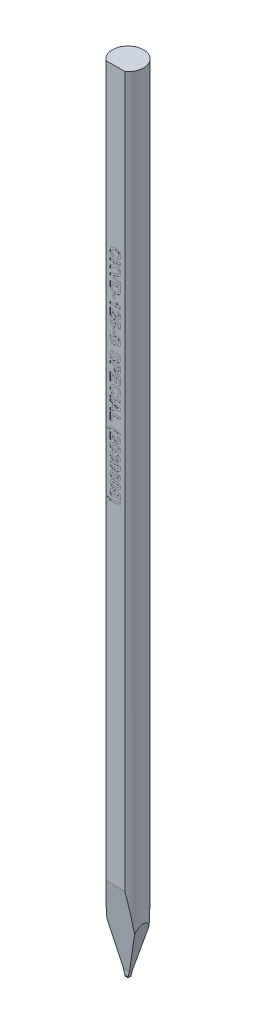
from build123d import *

# Parameters (mm, degrees)
SKETCH_TL_CUTTING_R       = 1.4986
TL_CUTTING_DEPTH          = 75.9968
SKETCH_TDF_GRINDING_W     = 3.0172
SKETCH_TDF_GRINDING_H     = 3.0172
TDF_GRINDING_DEPTH        = 77.026345527
SKETCH_ENGRAVING_W        = 0.166666667
SKETCH_ENGRAVING_H        = 0.371794872
SKETCH_ENGRAVING_W_2      = 1
SKETCH_ENGRAVING_H_2      = 0.192307693
ENGRAVING_DEPTH           = 0.005
VW_VR_GRINDING_DEPTH      = 1.5086
VW_VR_GRINDING_DEPTH_BACK = 1.5086
ISA_GRINDING_DEPTH        = 1.5086
ISA_GRINDING_DEPTH_BACK   = 1.5086
PRE_FRX_BRX_DEPTH         = 1.5086
PRE_FRX_BRX_DEPTH_BACK    = 1.5086
SKETCH_PRE_FRX_BRX_W      = 1.35874
SKETCH_PRE_FRX_BRX_H      = 0.6096
FR_EDM_R                  = 0.0381
BR_EDM_R                  = 0.0381
FA_BA_GRINDING_DEPTH      = 1.5086
FA_BA_GRINDING_DEPTH_BACK = 1.5086


with BuildPart() as part:
    # sketch_TL_cutting → TL_cutting (new body)
    with BuildSketch(Plane(origin=(0, 0, 0), x_dir=(1, 0, 0), z_dir=(0, 1, 0))):
        Circle(SKETCH_TL_CUTTING_R)
    extrude(amount=TL_CUTTING_DEPTH)

    # sketch_TDF_grinding → TDF_grinding (cut, through all)
    with BuildSketch(Plane(origin=(0, 0, 0), x_dir=(1, 0, 0), z_dir=(0, 1, 0))):
        with Locations((0, -2.71002)):
            Rectangle(SKETCH_TDF_GRINDING_W, SKETCH_TDF_GRINDING_H)
    extrude(amount=TDF_GRINDING_DEPTH, mode=Mode.SUBTRACT)

    # sketch_engraving → engraving (cut)
    # profile 1 of 26: a face of its own
    with BuildSketch(Plane.XY.offset(1.20142)):
        with BuildLine():
            Line((-0.128205128, 60.253210256), (-0.192307692, 60.060902564))
            add(Edge.make_bspline(
                [(-0.192307692, 60.060902564), (-0.204917923, 60.064809052), (-0.229612721, 60.072459184), (-0.2649877, 60.086537804), (-0.297871332, 60.102532008), (-0.328259475, 60.120359875), (-0.356049464, 60.140095258), (-0.381471598, 60.161589244), (-0.404368127, 60.185053424), (-0.424673345, 60.210470624), (-0.442633936, 60.237563711), (-0.457816548, 60.266656053), (-0.470893242, 60.29731117), (-0.481488041, 60.329840557), (-0.489972889, 60.364028151), (-0.495577171, 60.400034413), (-0.499377062, 60.437690896), (-0.499789062, 60.463403283), (-0.5, 60.476567628)],
                knots=[0, 0, 0, 0, 1.126670901, 2.206376047, 3.246533763, 4.245677351, 5.210506282, 6.152793389, 7.083980095, 8.004497442, 8.926231833, 9.854395169, 10.801995143, 11.768203916, 12.771938831, 13.805609698, 14.87650608, 16, 16, 16, 16], degree=3))
            add(Edge.make_bspline(
                [(-0.5, 60.476567628), (-0.499663994, 60.492816309), (-0.499003061, 60.524777949), (-0.492350465, 60.571519052), (-0.481969511, 60.616060328), (-0.467601869, 60.658469613), (-0.448555271, 60.698448786), (-0.42571373, 60.736373108), (-0.398318662, 60.771809391), (-0.367249987, 60.804950716), (-0.332452821, 60.835079196), (-0.294134751, 60.861072297), (-0.253074131, 60.883610491), (-0.208709772, 60.901536594), (-0.161353037, 60.915621791), (-0.110975156, 60.925468328), (-0.057578507, 60.931634942), (-0.020984357, 60.932337083), (-0.002203526, 60.932697436)],
                knots=[0, 0, 0, 0, 1.025134988, 2.016471176, 2.973446247, 3.909197306, 4.836872559, 5.763618465, 6.698581235, 7.658772073, 8.627106982, 9.597494692, 10.576422683, 11.578339294, 12.6118974, 13.690673505, 14.814808564, 16, 16, 16, 16], degree=3))
            add(Edge.make_bspline(
                [(-0.002203526, 60.932697436), (0.017576475, 60.9323292), (0.056163648, 60.931610839), (0.112313555, 60.925562878), (0.165084042, 60.915516768), (0.214577853, 60.901940058), (0.260470573, 60.883729249), (0.303160692, 60.861873909), (0.342311169, 60.835756152), (0.377833814, 60.805831091), (0.409480853, 60.772697852), (0.437377469, 60.736993428), (0.460593243, 60.698491041), (0.479896446, 60.657667336), (0.494630503, 60.614223397), (0.505304611, 60.568276602), (0.511505561, 60.519806054), (0.512376199, 60.48666808), (0.512820513, 60.469756731)],
                knots=[0, 0, 0, 0, 1.212773307, 2.365899439, 3.458117515, 4.504331001, 5.50806732, 6.480562534, 7.440239902, 8.387651817, 9.323121479, 10.245404239, 11.160468186, 12.07454208, 13.009500751, 13.96802424, 14.963018902, 16, 16, 16, 16], degree=3))
            add(Edge.make_bspline(
                [(0.512820513, 60.469756731), (0.512448361, 60.454987276), (0.511718707, 60.426029796), (0.506761415, 60.383624506), (0.498061698, 60.343436158), (0.486319015, 60.305247521), (0.470821797, 60.269275987), (0.451884357, 60.235457111), (0.429606892, 60.203674651), (0.412205553, 60.184525065), (0.403445513, 60.174884936)],
                knots=[0, 0, 0, 0, 1.098510076, 2.153775193, 3.169777012, 4.153122333, 5.120892526, 6.076995459, 7.031936742, 8, 8, 8, 8], degree=3))
            add(Edge.make_bspline(
                [(0.403445513, 60.174884936), (0.39787141, 60.169297644), (0.386592274, 60.157991818), (0.367549896, 60.142895368), (0.347050772, 60.128582058), (0.324745215, 60.115279068), (0.30046466, 60.103406849), (0.274581981, 60.092394097), (0.246997406, 60.082255069), (0.227800247, 60.076616604), (0.217948718, 60.073723077)],
                knots=[0, 0, 0, 0, 0.885292881, 1.791380647, 2.722937556, 3.69093542, 4.703306561, 5.754477758, 6.847650944, 8, 8, 8, 8], degree=3))
            Line((0.217948718, 60.073723077), (0.179487179, 60.266030769))
            add(Edge.make_bspline(
                [(0.179487179, 60.266030769), (0.1857949, 60.267665288), (0.198219456, 60.270884861), (0.21607256, 60.27739955), (0.233014714, 60.284871208), (0.248625569, 60.2941361), (0.263619506, 60.303962074), (0.277222328, 60.315624773), (0.290109132, 60.328129754), (0.301694454, 60.342018861), (0.312145605, 60.356893589), (0.321339918, 60.372603983), (0.329014435, 60.389188478), (0.335156827, 60.406521754), (0.340319842, 60.424545702), (0.34350638, 60.443432147), (0.345953545, 60.463015752), (0.3460861, 60.476358875), (0.346153846, 60.483178205)],
                knots=[0, 0, 0, 0, 1.051114734, 2.070420253, 3.064047898, 4.034553068, 4.997066449, 5.953344811, 6.921213386, 7.892675544, 8.867420182, 9.852654213, 10.826683617, 11.811917648, 12.818610352, 13.848120519, 14.900229319, 16, 16, 16, 16], degree=3))
            add(Edge.make_bspline(
                [(0.346153846, 60.483178205), (0.345958725, 60.492542256), (0.345576529, 60.51088423), (0.341532101, 60.53761448), (0.335695112, 60.563055692), (0.326982094, 60.58711706), (0.315677399, 60.609731698), (0.302244603, 60.631228905), (0.286035184, 60.651060806), (0.26758257, 60.669699764), (0.246135655, 60.686407721), (0.221779967, 60.701110652), (0.194212535, 60.713304121), (0.163711493, 60.723204409), (0.130202077, 60.730996736), (0.093641969, 60.736561162), (0.054005962, 60.739638434), (0.026581025, 60.740133903), (0.012419872, 60.740389744)],
                knots=[0, 0, 0, 0, 0.93816214, 1.837638998, 2.704791736, 3.551915875, 4.396257554, 5.235807848, 6.087970119, 6.959042444, 7.860386085, 8.80649345, 9.804409709, 10.875695391, 12.017327537, 13.250155505, 14.580089023, 16, 16, 16, 16], degree=3))
            add(Edge.make_bspline(
                [(0.012419872, 60.740389744), (-0.002609028, 60.740136423), (-0.031567402, 60.739648312), (-0.073337178, 60.736571685), (-0.111754322, 60.730971705), (-0.14688701, 60.723282849), (-0.178713725, 60.713332973), (-0.207179389, 60.701159106), (-0.23231734, 60.686686701), (-0.254110839, 60.669938275), (-0.272831387, 60.651337256), (-0.288926796, 60.631387439), (-0.302688307, 60.610206524), (-0.314010391, 60.587667053), (-0.322575422, 60.563683298), (-0.328786932, 60.538452371), (-0.332735688, 60.511881695), (-0.333131326, 60.493675799), (-0.333333333, 60.484380128)],
                knots=[0, 0, 0, 0, 1.475208372, 2.842499301, 4.107722225, 5.282836115, 6.369007568, 7.375918121, 8.315702116, 9.208439171, 10.065831443, 10.90006451, 11.71996243, 12.54067204, 13.369972975, 14.214060185, 15.088124569, 16, 16, 16, 16], degree=3))
            add(Edge.make_bspline(
                [(-0.333333333, 60.484380128), (-0.333161634, 60.477497953), (-0.332824013, 60.463965176), (-0.330681155, 60.443962689), (-0.326591822, 60.42476438), (-0.321184418, 60.406276281), (-0.314399721, 60.388426559), (-0.305696319, 60.37148748), (-0.295693052, 60.355125777), (-0.283969989, 60.33968094), (-0.270808612, 60.324946156), (-0.255597341, 60.311507159), (-0.238701667, 60.299041373), (-0.220008678, 60.287706947), (-0.199678377, 60.27712516), (-0.177394008, 60.268122121), (-0.153515697, 60.259734984), (-0.136789345, 60.255423153), (-0.128205128, 60.253210256)],
                knots=[0, 0, 0, 0, 0.980177776, 1.927374078, 2.859849964, 3.771585772, 4.668674471, 5.574490016, 6.479656464, 7.396337719, 8.332153134, 9.288470092, 10.28125149, 11.318486971, 12.398724812, 13.541284404, 14.738150009, 16, 16, 16, 16], degree=3))
        make_face()
    # profile 2 of 26: a face of its own
    with BuildSketch(Plane.XY.offset(1.20142)):
        Polygon((-0.5, 59.894235897), (0.5, 59.894235897), (0.5, 59.701928205), (0.052283654, 59.701928205), (0.5, 59.280253526), (0.5, 59.016030769), (0.11338141, 59.395838462), (-0.5, 59.003210256), (-0.5, 59.259420192), (-0.035456731, 59.541671795), (-0.198517628, 59.701928205), (-0.5, 59.701928205), align=None)
    # profile 3 of 26: a face of its own
    with BuildSketch(Plane.XY.offset(1.20142)):
        Polygon((-0.5, 58.627008333), (0.5, 58.9968), (0.5, 58.793675), (-0.243589744, 58.528851282), (0.5, 58.265029167), (0.5, 58.060902564), (-0.5, 58.429291987), align=None)
    # profile 4 of 26: a face of its own
    with BuildSketch(Plane.XY.offset(1.20142)):
        with BuildLine():
            Line((0.5, 57.971158974), (0.5, 57.604372115))
            add(Edge.make_bspline(
                [(0.5, 57.604372115), (0.500005193, 57.594354571), (0.500015306, 57.574848084), (0.498840892, 57.546539066), (0.497659587, 57.520066494), (0.495294873, 57.495506352), (0.492816233, 57.472773432), (0.489678088, 57.451826942), (0.485656212, 57.432799202), (0.482484481, 57.420800319), (0.480969551, 57.415069231)],
                knots=[0, 0, 0, 0, 1.259756885, 2.453039283, 3.563158368, 4.591894114, 5.55549294, 6.43918076, 7.254497783, 8, 8, 8, 8], degree=3))
            add(Edge.make_bspline(
                [(0.480969551, 57.415069231), (0.478637325, 57.407900254), (0.474014881, 57.393691431), (0.465827813, 57.372838378), (0.455960096, 57.353004479), (0.445111978, 57.333729819), (0.432903728, 57.315457553), (0.419595761, 57.297742873), (0.404753223, 57.281109803), (0.383633179, 57.25957514), (0.35420815, 57.235150255), (0.315375005, 57.20931972), (0.272594656, 57.187582014), (0.234409605, 57.172390641), (0.20183843, 57.162346542), (0.175754603, 57.155778141), (0.148301213, 57.150106468), (0.119383738, 57.145856292), (0.08913491, 57.142194906), (0.057465542, 57.139567238), (0.024383276, 57.13826625), (0.001870575, 57.137974494), (-0.009615385, 57.137825641)],
                knots=[0, 0, 0, 0, 0.745431882, 1.477436776, 2.212739876, 2.934276521, 3.663147754, 4.384200836, 5.123377481, 5.865761747, 7.365547505, 8.894711587, 10.468722596, 12.101948761, 12.951987285, 13.837595333, 14.760899389, 15.722756883, 16.726861385, 17.773652936, 18.864119771, 20, 20, 20, 20], degree=3))
            add(Edge.make_bspline(
                [(-0.009615385, 57.137825641), (-0.0294616, 57.138217046), (-0.067834928, 57.13897384), (-0.123301552, 57.144571211), (-0.17465514, 57.153866648), (-0.206804138, 57.163577075), (-0.222355769, 57.168274359)],
                knots=[0, 0, 0, 0, 1.103491527, 2.133638164, 3.0971734, 4, 4, 4, 4], degree=3))
            add(Edge.make_bspline(
                [(-0.222355769, 57.168274359), (-0.231274521, 57.171448003), (-0.248819098, 57.177691057), (-0.274127236, 57.188615932), (-0.298211673, 57.200420337), (-0.321053432, 57.213202184), (-0.342549771, 57.227026052), (-0.362636394, 57.241943645), (-0.381577746, 57.257723731), (-0.393236239, 57.26915549), (-0.399038462, 57.274844872)],
                knots=[0, 0, 0, 0, 1.090884612, 2.145940218, 3.175104604, 4.181306866, 5.161203701, 6.118658341, 7.063689906, 8, 8, 8, 8], degree=3))
            add(Edge.make_bspline(
                [(-0.399038462, 57.274844872), (-0.407300305, 57.284131145), (-0.424264154, 57.303198431), (-0.445652736, 57.33654995), (-0.464086504, 57.374425276), (-0.473760833, 57.401739168), (-0.478766026, 57.415870513)],
                knots=[0, 0, 0, 0, 0.912008655, 1.872605891, 2.89935344, 4, 4, 4, 4], degree=3))
            add(Edge.make_bspline(
                [(-0.478766026, 57.415870513), (-0.4805228, 57.421590486), (-0.484168894, 57.433461996), (-0.488062998, 57.452285444), (-0.492165475, 57.472379947), (-0.49463687, 57.493977223), (-0.497243066, 57.516853081), (-0.498706299, 57.541189822), (-0.49974511, 57.566903081), (-0.499913777, 57.584539175), (-0.5, 57.593554808)],
                knots=[0, 0, 0, 0, 0.799129865, 1.658552685, 2.566799617, 3.538529252, 4.561352959, 5.643373779, 6.795284424, 8, 8, 8, 8], degree=3))
            Line((-0.5, 57.593554808), (-0.5, 57.971158974))
            Line((-0.5, 57.971158974), (0.5, 57.971158974))
        make_face()
        with BuildLine():
            Line((0.333333333, 57.778851282), (-0.333333333, 57.778851282))
            Line((-0.333333333, 57.778851282), (-0.333333333, 57.620598077))
            add(Edge.make_bspline(
                [(-0.333333333, 57.620598077), (-0.333276671, 57.61345336), (-0.333167574, 57.599697049), (-0.332847006, 57.579791316), (-0.331979167, 57.561498115), (-0.331080228, 57.544721614), (-0.329595022, 57.52950549), (-0.328134266, 57.515783535), (-0.326090699, 57.503632132), (-0.324477534, 57.496127127), (-0.323717949, 57.492593269)],
                knots=[0, 0, 0, 0, 1.333384787, 2.567275092, 3.714769766, 4.750907381, 5.701951617, 6.567520054, 7.325492842, 8, 8, 8, 8], degree=3))
            add(Edge.make_bspline(
                [(-0.323717949, 57.492593269), (-0.321509316, 57.484316575), (-0.317207482, 57.468195757), (-0.307617456, 57.445560499), (-0.296048139, 57.425078507), (-0.282136533, 57.40640677), (-0.26455548, 57.38957967), (-0.242070693, 57.375215683), (-0.215254411, 57.361922192), (-0.189584523, 57.352818806), (-0.16665678, 57.346284413), (-0.147412959, 57.341861165), (-0.126593091, 57.338365591), (-0.104279343, 57.335358942), (-0.080500412, 57.332929499), (-0.055170426, 57.331417784), (-0.028320392, 57.330386029), (-0.009883527, 57.330219161), (-0.000400641, 57.330133333)],
                knots=[0, 0, 0, 0, 1.038686998, 2.023088296, 2.974059649, 3.888265163, 4.839857954, 5.909819677, 7.113156087, 8.466843969, 9.20827164, 10.006482943, 10.861893492, 11.769681931, 12.739021491, 13.762258324, 14.849031541, 16, 16, 16, 16], degree=3))
            add(Edge.make_bspline(
                [(-0.000400641, 57.330133333), (0.009082275, 57.3302185), (0.027452469, 57.330383485), (0.054102292, 57.331413664), (0.079033415, 57.332916863), (0.102276578, 57.335363691), (0.123864169, 57.338323456), (0.143813574, 57.341860891), (0.161996804, 57.346254423), (0.183589283, 57.352807511), (0.207947697, 57.362644996), (0.23429421, 57.376471199), (0.2571147, 57.392736402), (0.276689574, 57.411091558), (0.29287817, 57.432178569), (0.306422028, 57.455549371), (0.316938162, 57.481680279), (0.321416742, 57.500269318), (0.323717949, 57.509820833)],
                knots=[0, 0, 0, 0, 1.118059345, 2.165891593, 3.144157881, 4.062285166, 4.920717571, 5.712910489, 6.449981617, 7.12489426, 8.371943983, 9.541298068, 10.624898781, 11.666293176, 12.69306237, 13.747704633, 14.842713931, 16, 16, 16, 16], degree=3))
            add(Edge.make_bspline(
                [(0.323717949, 57.509820833), (0.324486218, 57.513955143), (0.326177652, 57.523057311), (0.328151987, 57.538161571), (0.329628909, 57.555948179), (0.331099472, 57.576377116), (0.331977905, 57.599427064), (0.332859431, 57.625132571), (0.333166326, 57.653516851), (0.333276065, 57.673349207), (0.333333333, 57.683699038)],
                knots=[0, 0, 0, 0, 0.578739524, 1.274162912, 2.095457587, 3.035141998, 4.093102578, 5.270121571, 6.575369351, 8, 8, 8, 8], degree=3))
            Line((0.333333333, 57.683699038), (0.333333333, 57.778851282))
        make_face(mode=Mode.SUBTRACT)
    # profile 5 of 26: a face of its own
    with BuildSketch(Plane.XY.offset(1.20142)):
        with Locations((-0.147435898, 56.810902564)):
            Rectangle(SKETCH_ENGRAVING_W, SKETCH_ENGRAVING_H)
    # profile 6 of 26: a face of its own
    with BuildSketch(Plane.XY.offset(1.20142)):
        with BuildLine():
            Line((-0.5, 56.073723077), (-0.5, 56.266030769))
            Line((-0.5, 56.266030769), (0.211939103, 56.266030769))
            add(Edge.make_bspline(
                [(0.211939103, 56.266030769), (0.20307606, 56.274734852), (0.185434563, 56.292059945), (0.161132143, 56.319898193), (0.138107764, 56.348429498), (0.117325964, 56.378488613), (0.097979723, 56.409495994), (0.080691796, 56.441850822), (0.064587624, 56.475051895), (0.055729116, 56.498066792), (0.051282051, 56.509620513)],
                knots=[0, 0, 0, 0, 1.012608143, 2.015552075, 3.011331447, 4.000718745, 4.993456561, 5.989905615, 6.990911433, 8, 8, 8, 8], degree=3))
            Line((0.051282051, 56.509620513), (0.243589744, 56.509620513))
            add(Edge.make_bspline(
                [(0.243589744, 56.509620513), (0.248390063, 56.496812321), (0.258436757, 56.470005773), (0.279872721, 56.430420485), (0.306240788, 56.389010478), (0.332145905, 56.35426628), (0.355392216, 56.326940145), (0.373871139, 56.307698315), (0.392879523, 56.289874424), (0.412934946, 56.274123655), (0.433647484, 56.260045979), (0.454979242, 56.247571891), (0.476998664, 56.236591997), (0.492332462, 56.230844073), (0.5, 56.227969872)],
                knots=[0, 0, 0, 0, 1.253621181, 2.623731602, 4.119264342, 5.756158754, 6.594718004, 7.409281336, 8.202581069, 8.983291728, 9.746205797, 10.498494251, 11.24918464, 12, 12, 12, 12], degree=3))
            Line((0.5, 56.227969872), (0.5, 56.073723077))
            Line((0.5, 56.073723077), (-0.5, 56.073723077))
        make_face()
    # profile 7 of 26: a face of its own
    with BuildSketch(Plane.XY.offset(1.20142)):
        with BuildLine():
            Line((-0.307692308, 55.137825641), (-0.5, 55.137825641))
            Line((-0.5, 55.137825641), (-0.5, 55.791671795))
            add(Edge.make_bspline(
                [(-0.5, 55.791671795), (-0.483565984, 55.78945373), (-0.450707166, 55.785018845), (-0.402658764, 55.771392053), (-0.355879438, 55.752867325), (-0.317848438, 55.732961803), (-0.286923212, 55.713605861), (-0.262057708, 55.695394141), (-0.235074392, 55.674364437), (-0.206603976, 55.649813805), (-0.176093602, 55.622354752), (-0.14381225, 55.591645754), (-0.109876761, 55.557589959), (-0.086834533, 55.533628881), (-0.074919872, 55.521239103)],
                knots=[0, 0, 0, 0, 1.156381417, 2.312114436, 3.475445649, 4.663832578, 5.302694182, 6.020660876, 6.814180865, 7.69035705, 8.644181007, 9.679458435, 10.800095821, 12, 12, 12, 12], degree=3))
            add(Edge.make_bspline(
                [(-0.074919872, 55.521239103), (-0.065377972, 55.511350203), (-0.047213006, 55.492524652), (-0.021173696, 55.465746037), (0.002635387, 55.442138859), (0.024062885, 55.42156659), (0.042867348, 55.403755407), (0.059484162, 55.389184125), (0.073602098, 55.377398337), (0.082565079, 55.371021256), (0.086538462, 55.368194231)],
                knots=[0, 0, 0, 0, 1.480739016, 2.818890974, 4.024686436, 5.093297083, 6.019761393, 6.815071481, 7.474708909, 8, 8, 8, 8], degree=3))
            add(Edge.make_bspline(
                [(0.086538462, 55.368194231), (0.096145343, 55.362375339), (0.114654059, 55.351164601), (0.143960972, 55.33930553), (0.173010268, 55.331565463), (0.192528875, 55.330605306), (0.202123397, 55.330133333)],
                knots=[0, 0, 0, 0, 1.091434863, 2.102769638, 3.067401785, 4, 4, 4, 4], degree=3))
            add(Edge.make_bspline(
                [(0.202123397, 55.330133333), (0.212103794, 55.330486794), (0.230985925, 55.331155515), (0.257559137, 55.336948518), (0.280564781, 55.346776582), (0.299731306, 55.360789793), (0.314878913, 55.37843879), (0.325894297, 55.399195821), (0.332110851, 55.423133647), (0.33291372, 55.43993959), (0.333333333, 55.448723077)],
                knots=[0, 0, 0, 0, 1.192552326, 2.256215989, 3.232470907, 4.163657734, 5.069678789, 5.991331675, 6.950186205, 8, 8, 8, 8], degree=3))
            add(Edge.make_bspline(
                [(0.333333333, 55.448723077), (0.332938162, 55.457445314), (0.332174776, 55.474294793), (0.325505939, 55.498241559), (0.313961482, 55.519190559), (0.30080546, 55.534119931), (0.288012183, 55.544205429), (0.276863686, 55.551077336), (0.264195574, 55.557000384), (0.250150469, 55.562248698), (0.23456747, 55.566394273), (0.217565257, 55.569732861), (0.199052334, 55.57242328), (0.186173423, 55.573278881), (0.179487179, 55.573723077)],
                knots=[0, 0, 0, 0, 1.402788338, 2.709884207, 3.961032948, 5.225417836, 5.883680772, 6.578928686, 7.329201998, 8.132101139, 8.990263233, 9.922304639, 10.921339128, 12, 12, 12, 12], degree=3))
            Line((0.179487179, 55.573723077), (0.198317308, 55.766030769))
            add(Edge.make_bspline(
                [(0.198317308, 55.766030769), (0.211300501, 55.764484645), (0.236472838, 55.761486958), (0.272628993, 55.754006178), (0.305984679, 55.744532048), (0.336477992, 55.732612904), (0.364302841, 55.718741378), (0.389041697, 55.702209908), (0.410968596, 55.68359612), (0.430071868, 55.662883927), (0.446412285, 55.640205005), (0.460998615, 55.616407545), (0.472964043, 55.591026479), (0.482825353, 55.564341253), (0.490706433, 55.536363927), (0.495917297, 55.506965102), (0.499582638, 55.476326216), (0.499858783, 55.455411985), (0.5, 55.444716667)],
                knots=[0, 0, 0, 0, 1.270971563, 2.464210789, 3.586263665, 4.638946707, 5.643716971, 6.603612468, 7.52484387, 8.434700188, 9.336036235, 10.239171475, 11.145359471, 12.059630629, 13.003312604, 13.96741569, 14.960557767, 16, 16, 16, 16], degree=3))
            add(Edge.make_bspline(
                [(0.5, 55.444716667), (0.499776553, 55.433089459), (0.499341362, 55.410444013), (0.495746905, 55.377385933), (0.489481026, 55.346329303), (0.48117587, 55.317006916), (0.470106061, 55.289704654), (0.456633778, 55.264201031), (0.440545401, 55.240755198), (0.422288069, 55.219341878), (0.402418882, 55.20012264), (0.380890105, 55.183668357), (0.358545244, 55.169222556), (0.334632005, 55.157882632), (0.309750235, 55.148643646), (0.283460918, 55.14269893), (0.256153456, 55.13835187), (0.237464899, 55.138002991), (0.227964744, 55.137825641)],
                knots=[0, 0, 0, 0, 1.21054264, 2.357683783, 3.456743179, 4.506371233, 5.526380269, 6.518616322, 7.504105716, 8.480749833, 9.444588379, 10.376395364, 11.298423092, 12.209585683, 13.126776925, 14.056012185, 15.011791738, 16, 16, 16, 16], degree=3))
            add(Edge.make_bspline(
                [(0.227964744, 55.137825641), (0.217064496, 55.138070753), (0.195440077, 55.138557019), (0.163469012, 55.143197463), (0.132249846, 55.15032211), (0.101610438, 55.16072983), (0.071147148, 55.174402099), (0.040108962, 55.191139636), (0.008522341, 55.211412701), (-0.012178306, 55.226838447), (-0.022836538, 55.234780769)],
                knots=[0, 0, 0, 0, 0.953498, 1.891593709, 2.82157134, 3.753035249, 4.718494268, 5.740911752, 6.836853288, 8, 8, 8, 8], degree=3))
            add(Edge.make_bspline(
                [(-0.022836538, 55.234780769), (-0.026670091, 55.237819514), (-0.034880672, 55.2443278), (-0.047378398, 55.2554334), (-0.061345658, 55.268037883), (-0.076193638, 55.282719221), (-0.092563957, 55.298938211), (-0.109838998, 55.317124609), (-0.128325502, 55.337094679), (-0.147648705, 55.35804585), (-0.166391428, 55.379206854), (-0.184247543, 55.398553147), (-0.20029985, 55.415885953), (-0.214732899, 55.431037917), (-0.227268639, 55.444275167), (-0.238167377, 55.455345188), (-0.247265417, 55.464426315), (-0.26144337, 55.476942593), (-0.280620183, 55.492867112), (-0.298943771, 55.504070955), (-0.307692308, 55.509420192)],
                knots=[0, 0, 0, 0, 0.665546509, 1.425446362, 2.274432636, 3.225431318, 4.2662943, 5.410247296, 6.638261485, 7.969509561, 9.288545809, 10.484715594, 11.551975365, 12.503234464, 13.332293902, 14.032657109, 14.617374704, 15.080693821, 16.606187002, 18, 18, 18, 18], degree=3))
            Line((-0.307692308, 55.509420192), (-0.307692308, 55.137825641))
        make_face()
    # profile 8 of 26: a face of its own
    with BuildSketch(Plane.XY.offset(1.20142)):
        with BuildLine():
            Line((-0.213942308, 55.022441026), (-0.192307692, 54.855774359))
            add(Edge.make_bspline(
                [(-0.192307692, 54.855774359), (-0.203607347, 54.853925287), (-0.225366694, 54.850364594), (-0.255826929, 54.839402289), (-0.282470914, 54.823774379), (-0.305088238, 54.804100221), (-0.323334969, 54.781657307), (-0.336523954, 54.756988423), (-0.344692684, 54.73061856), (-0.34566455, 54.712335111), (-0.346153846, 54.703130128)],
                knots=[0, 0, 0, 0, 1.155217688, 2.224562036, 3.249849536, 4.259092678, 5.238040954, 6.15568152, 7.071459712, 8, 8, 8, 8], degree=3))
            add(Edge.make_bspline(
                [(-0.346153846, 54.703130128), (-0.346059894, 54.697781574), (-0.34587598, 54.687311695), (-0.34378776, 54.671882996), (-0.340396301, 54.657143672), (-0.335789422, 54.642957438), (-0.329745146, 54.629460443), (-0.322266898, 54.616637002), (-0.313608966, 54.604329211), (-0.303697677, 54.592693735), (-0.29215854, 54.582251042), (-0.27939506, 54.572976485), (-0.265101057, 54.5653888), (-0.249674797, 54.558847437), (-0.232663378, 54.554219777), (-0.214481969, 54.550508153), (-0.194883734, 54.548622529), (-0.18142672, 54.548266079), (-0.174479167, 54.548082051)],
                knots=[0, 0, 0, 0, 0.98109136, 1.920501424, 2.850996269, 3.75396817, 4.653607445, 5.559568228, 6.474190795, 7.412641135, 8.358186253, 9.324081521, 10.300185094, 11.322066343, 12.392681767, 13.529496655, 14.72453472, 16, 16, 16, 16], degree=3))
            add(Edge.make_bspline(
                [(-0.174479167, 54.548082051), (-0.167930185, 54.548186011), (-0.155273198, 54.54838693), (-0.136935362, 54.550250991), (-0.119798482, 54.553112314), (-0.103987864, 54.557664229), (-0.089209555, 54.562862865), (-0.075987454, 54.569871975), (-0.063746794, 54.577562624), (-0.053149329, 54.586936842), (-0.04378212, 54.597149194), (-0.035449479, 54.608031526), (-0.028416647, 54.619729056), (-0.022600846, 54.632131092), (-0.018105451, 54.64529127), (-0.015265585, 54.659238292), (-0.013079926, 54.673815526), (-0.012907894, 54.683823789), (-0.012820513, 54.688907372)],
                knots=[0, 0, 0, 0, 1.292262537, 2.497510385, 3.635136149, 4.715991128, 5.741845981, 6.720379908, 7.663568786, 8.58853187, 9.502632107, 10.396263742, 11.289117461, 12.191261909, 13.095714127, 14.026387781, 14.997526353, 16, 16, 16, 16], degree=3))
            add(Edge.make_bspline(
                [(-0.012820513, 54.688907372), (-0.013050924, 54.695334203), (-0.013510598, 54.708155832), (-0.017247301, 54.72708286), (-0.02333068, 54.745505311), (-0.031799166, 54.763404039), (-0.042720432, 54.780731687), (-0.056130694, 54.797413237), (-0.071799231, 54.813735037), (-0.083638008, 54.823760833), (-0.08974359, 54.82893141)],
                knots=[0, 0, 0, 0, 0.931687088, 1.85873035, 2.786835662, 3.740075265, 4.723687035, 5.750832598, 6.840042753, 8, 8, 8, 8], degree=3))
            Line((-0.08974359, 54.82893141), (-0.066105769, 54.9968))
            Line((-0.066105769, 54.9968), (0.487179487, 54.881415385))
            Line((0.487179487, 54.881415385), (0.487179487, 54.394235897))
            Line((0.487179487, 54.394235897), (0.294871795, 54.394235897))
            Line((0.294871795, 54.394235897), (0.294871795, 54.72716859))
            Line((0.294871795, 54.72716859), (0.116386218, 54.76643141))
            add(Edge.make_bspline(
                [(0.116386218, 54.76643141), (0.122158957, 54.756426118), (0.133400829, 54.736941744), (0.144973305, 54.705834811), (0.152400706, 54.674568082), (0.153366831, 54.653490949), (0.153846154, 54.643033974)],
                knots=[0, 0, 0, 0, 1.060051984, 2.064352337, 3.039669322, 4, 4, 4, 4], degree=3))
            add(Edge.make_bspline(
                [(0.153846154, 54.643033974), (0.153581613, 54.63320353), (0.153059042, 54.613784594), (0.148771515, 54.585305103), (0.141705229, 54.557987857), (0.131871753, 54.531740611), (0.118982632, 54.506751105), (0.103404168, 54.482803913), (0.084866032, 54.460244757), (0.063903438, 54.438831251), (0.04071085, 54.419303636), (0.015420507, 54.402439987), (-0.011337699, 54.387874676), (-0.039859413, 54.376016787), (-0.070184315, 54.367087457), (-0.102051282, 54.360400252), (-0.135661543, 54.356654127), (-0.158578281, 54.356071611), (-0.170272436, 54.355774359)],
                knots=[0, 0, 0, 0, 0.974409932, 1.924837087, 2.848242317, 3.768103797, 4.697919751, 5.630842317, 6.595644344, 7.588240789, 8.59876155, 9.595918743, 10.597287627, 11.615415169, 12.652315553, 13.727511434, 14.840374562, 16, 16, 16, 16], degree=3))
            add(Edge.make_bspline(
                [(-0.170272436, 54.355774359), (-0.180095164, 54.356040651), (-0.199591316, 54.356569189), (-0.228431015, 54.359713123), (-0.256480502, 54.365423218), (-0.283660862, 54.373230645), (-0.310181667, 54.383074441), (-0.335760069, 54.395318254), (-0.360613268, 54.409811181), (-0.376286294, 54.421018447), (-0.384214744, 54.426687821)],
                knots=[0, 0, 0, 0, 1.0275977, 2.039576086, 3.029943557, 4.018141221, 4.995043124, 5.985410594, 6.980887897, 8, 8, 8, 8], degree=3))
            add(Edge.make_bspline(
                [(-0.384214744, 54.426687821), (-0.39442561, 54.434949332), (-0.414521783, 54.451208948), (-0.440928765, 54.479051257), (-0.463196136, 54.509349396), (-0.481238657, 54.542072985), (-0.495700415, 54.576950225), (-0.505577236, 54.614346022), (-0.511741284, 54.653979771), (-0.51245553, 54.681205058), (-0.512820513, 54.695117308)],
                knots=[0, 0, 0, 0, 1.018155984, 2.003849412, 2.967446846, 3.927472908, 4.896208823, 5.888955604, 6.921246412, 8, 8, 8, 8], degree=3))
            add(Edge.make_bspline(
                [(-0.512820513, 54.695117308), (-0.51261689, 54.70634638), (-0.512219305, 54.728271757), (-0.508313832, 54.760385425), (-0.50189785, 54.790864306), (-0.493201931, 54.819853414), (-0.481586571, 54.847077466), (-0.467806969, 54.872870679), (-0.451267563, 54.897036267), (-0.432181131, 54.919432086), (-0.411081442, 54.939996376), (-0.387995531, 54.958339148), (-0.363308362, 54.974659322), (-0.336770788, 54.98864566), (-0.308568836, 55.00056532), (-0.278557994, 55.010056256), (-0.246938394, 55.017870613), (-0.225062746, 55.020900692), (-0.213942308, 55.022441026)],
                knots=[0, 0, 0, 0, 1.098896741, 2.145655864, 3.16104256, 4.145315902, 5.10323158, 6.053780891, 7.003858069, 7.963890296, 8.930045353, 9.883557002, 10.846278307, 11.82296847, 12.816080213, 13.83936887, 14.901647787, 16, 16, 16, 16], degree=3))
        make_face()
    # profile 9 of 26: a face of its own
    with BuildSketch(Plane.XY.offset(1.20142)):
        with Locations((-0.147435898, 54.041671795)):
            Rectangle(SKETCH_ENGRAVING_W, SKETCH_ENGRAVING_H)
    # profile 10 of 26: a face of its own
    with BuildSketch(Plane.XY.offset(1.20142)):
        with BuildLine():
            Line((-0.128205128, 53.291671795), (0.038461538, 53.291671795))
            Line((0.038461538, 53.291671795), (0.038461538, 52.855774359))
            Line((0.038461538, 52.855774359), (-0.36338141, 52.855774359))
            add(Edge.make_bspline(
                [(-0.36338141, 52.855774359), (-0.368321434, 52.861260375), (-0.378419843, 52.8724749), (-0.392661125, 52.890772664), (-0.406257259, 52.910916779), (-0.4194836, 52.932785469), (-0.432233696, 52.956423992), (-0.444685123, 52.981738064), (-0.45671611, 53.008774391), (-0.471787381, 53.047007711), (-0.488186169, 53.09622183), (-0.502445448, 53.156387076), (-0.511191227, 53.217028267), (-0.512277771, 53.257589075), (-0.512820513, 53.277849679)],
                knots=[0, 0, 0, 0, 0.581799769, 1.189316438, 1.825828404, 2.496525428, 3.203088405, 3.942228803, 4.719818701, 5.534979611, 7.181138583, 8.803804008, 10.403462225, 12, 12, 12, 12], degree=3))
            add(Edge.make_bspline(
                [(-0.512820513, 53.277849679), (-0.512629241, 53.290542166), (-0.512252188, 53.315562831), (-0.509233571, 53.352501118), (-0.504017902, 53.388218224), (-0.496780719, 53.422650736), (-0.487836372, 53.455901646), (-0.476607913, 53.487854166), (-0.463065488, 53.518474068), (-0.447986133, 53.547990581), (-0.430657849, 53.575843177), (-0.411724289, 53.602087023), (-0.390891397, 53.626467404), (-0.36853351, 53.649196217), (-0.344060025, 53.669844803), (-0.318106216, 53.688926641), (-0.290219674, 53.705985038), (-0.260879177, 53.721311559), (-0.230317098, 53.734940942), (-0.198781008, 53.746443246), (-0.166726875, 53.756526922), (-0.134042675, 53.764814707), (-0.10062201, 53.770901654), (-0.066619552, 53.775633529), (-0.031822841, 53.778175004), (-0.008417054, 53.778624325), (0.003405449, 53.778851282)],
                knots=[0, 0, 0, 0, 1.124897971, 2.217508473, 3.282174662, 4.322209414, 5.334422951, 6.332119154, 7.320662553, 8.300074908, 9.267468154, 10.225199689, 11.165658754, 12.107290334, 13.047749399, 14.00069605, 14.959944213, 15.942088746, 16.933021067, 17.923599838, 18.915715637, 19.910475908, 20.909926025, 21.925232038, 22.952013513, 24, 24, 24, 24], degree=3))
            add(Edge.make_bspline(
                [(0.003405449, 53.778851282), (0.016165747, 53.778667383), (0.041321811, 53.778304838), (0.078501182, 53.775175194), (0.114594914, 53.770327239), (0.149519517, 53.762932247), (0.183523729, 53.754078796), (0.216299841, 53.742734109), (0.248180515, 53.729780661), (0.278688999, 53.714496543), (0.308028284, 53.697613971), (0.335510174, 53.6784304), (0.361403632, 53.6576108), (0.385591047, 53.634967968), (0.407627145, 53.610129007), (0.428063784, 53.583603308), (0.447146094, 53.55540846), (0.457908016, 53.535231736), (0.463341346, 53.525045192)],
                knots=[0, 0, 0, 0, 1.105132952, 2.178694671, 3.229818344, 4.257558797, 5.269123684, 6.27148554, 7.259679084, 8.247804916, 9.224967877, 10.189258471, 11.147685264, 12.101072275, 13.055511435, 14.02039165, 15.000562851, 16, 16, 16, 16], degree=3))
            add(Edge.make_bspline(
                [(0.463341346, 53.525045192), (0.467347168, 53.516957841), (0.475455657, 53.500587618), (0.485329628, 53.474514525), (0.494054347, 53.447146948), (0.500719187, 53.418165473), (0.506115234, 53.387878993), (0.510216979, 53.356137917), (0.512307439, 53.322883708), (0.512647258, 53.300221284), (0.512820513, 53.288666987)],
                knots=[0, 0, 0, 0, 0.887950456, 1.797368171, 2.741221183, 3.713797788, 4.722103116, 5.768966405, 6.862521341, 8, 8, 8, 8], degree=3))
            add(Edge.make_bspline(
                [(0.512820513, 53.288666987), (0.512598613, 53.273769487), (0.512167059, 53.244796604), (0.508571106, 53.20255631), (0.502373597, 53.162802674), (0.493837942, 53.125480334), (0.482863355, 53.090669697), (0.469371425, 53.058430687), (0.453633675, 53.028565429), (0.435019378, 53.001506485), (0.414494937, 52.976703918), (0.392035387, 52.954222449), (0.367607461, 52.934053031), (0.341334074, 52.916182318), (0.313106625, 52.900750967), (0.283182558, 52.887482952), (0.251334696, 52.876561769), (0.22921692, 52.871283803), (0.217948718, 52.868594872)],
                knots=[0, 0, 0, 0, 1.271135529, 2.472123572, 3.614091059, 4.701890498, 5.736279567, 6.724681829, 7.680621489, 8.611506429, 9.52200816, 10.424540711, 11.318996785, 12.221421405, 13.131851814, 14.060431888, 15.011860567, 16, 16, 16, 16], degree=3))
            Line((0.217948718, 52.868594872), (0.179487179, 53.060902564))
            add(Edge.make_bspline(
                [(0.179487179, 53.060902564), (0.185798707, 53.062805146), (0.198251232, 53.066558905), (0.216108293, 53.073865481), (0.232994438, 53.082183603), (0.248643132, 53.092010597), (0.263649233, 53.102448251), (0.277161531, 53.114718435), (0.290187329, 53.127625453), (0.301701762, 53.142116609), (0.312086782, 53.157555164), (0.321450083, 53.173776632), (0.329043783, 53.191144974), (0.335153652, 53.209417597), (0.340342569, 53.228505002), (0.343533767, 53.24865634), (0.345940549, 53.2696453), (0.346081986, 53.283985325), (0.346153846, 53.291271154)],
                knots=[0, 0, 0, 0, 1.027780279, 2.027791312, 3.006028774, 3.96000864, 4.908113241, 5.852721087, 6.802883308, 7.765918715, 8.733730415, 9.704005314, 10.683351261, 11.68471758, 12.707948499, 13.764514378, 14.864202456, 16, 16, 16, 16], degree=3))
            add(Edge.make_bspline(
                [(0.346153846, 53.291271154), (0.345859633, 53.302298511), (0.34528545, 53.323819337), (0.341538784, 53.355236876), (0.334873123, 53.384876442), (0.325679114, 53.41281554), (0.313877959, 53.439105391), (0.299029501, 53.463390737), (0.282012344, 53.48627627), (0.262039987, 53.507110747), (0.239645267, 53.52600525), (0.214561065, 53.542361822), (0.186868462, 53.555978599), (0.156706511, 53.567131515), (0.124073954, 53.576011616), (0.088855272, 53.582035764), (0.051104495, 53.585971833), (0.02505068, 53.586349093), (0.01161859, 53.58654359)],
                knots=[0, 0, 0, 0, 1.043810997, 2.037086103, 2.989314757, 3.91471467, 4.817033861, 5.710208705, 6.603920097, 7.511448416, 8.435617211, 9.371747005, 10.338444094, 11.350425613, 12.411431869, 13.5347293, 14.729025275, 16, 16, 16, 16], degree=3))
            add(Edge.make_bspline(
                [(0.01161859, 53.58654359), (-0.002813331, 53.586340916), (-0.03086261, 53.585947007), (-0.071503034, 53.582112106), (-0.109371212, 53.575813885), (-0.14440027, 53.566746527), (-0.176807311, 53.555439264), (-0.206438048, 53.541459735), (-0.233109204, 53.524651899), (-0.256980675, 53.505589064), (-0.278169336, 53.484552253), (-0.296147735, 53.461489293), (-0.31184176, 53.437231086), (-0.32420794, 53.411091286), (-0.33413508, 53.383542798), (-0.341078682, 53.354316769), (-0.345395871, 53.323518498), (-0.345897627, 53.302436945), (-0.346153846, 53.291671795)],
                knots=[0, 0, 0, 0, 1.31821493, 2.562027667, 3.72541598, 4.821825939, 5.863743127, 6.857000185, 7.808227391, 8.737146514, 9.643023621, 10.529087527, 11.404035307, 12.277173472, 13.164790074, 14.074766194, 15.016892606, 16, 16, 16, 16], degree=3))
            add(Edge.make_bspline(
                [(-0.346153846, 53.291671795), (-0.345850315, 53.280768504), (-0.34524035, 53.258857617), (-0.340086045, 53.226036537), (-0.332449955, 53.193036283), (-0.321065283, 53.160643933), (-0.307937779, 53.129257225), (-0.292687307, 53.100091024), (-0.276962331, 53.072698447), (-0.264654274, 53.056185969), (-0.258613782, 53.048082051)],
                knots=[0, 0, 0, 0, 0.993779204, 1.997065276, 3.023588959, 4.078879359, 5.123947549, 6.123456565, 7.079038607, 8, 8, 8, 8], degree=3))
            Line((-0.258613782, 53.048082051), (-0.128205128, 53.048082051))
            Line((-0.128205128, 53.048082051), (-0.128205128, 53.291671795))
        make_face()
    # profile 11 of 26: a face of its own
    with BuildSketch(Plane.XY.offset(1.20142)):
        with BuildLine():
            Line((-0.166666667, 52.330133333), (-0.153846154, 52.137825641))
            add(Edge.make_bspline(
                [(-0.153846154, 52.137825641), (-0.161891279, 52.136292992), (-0.177518424, 52.133315918), (-0.199795017, 52.126712009), (-0.220541784, 52.119405841), (-0.239662803, 52.110792964), (-0.25710555, 52.100927896), (-0.273156714, 52.090137618), (-0.28732832, 52.077894862), (-0.299925293, 52.064563176), (-0.310783278, 52.049989999), (-0.320246275, 52.034289399), (-0.328256178, 52.017368131), (-0.334922245, 51.999290819), (-0.339885492, 51.979877406), (-0.343420115, 51.959309762), (-0.345682646, 51.937554761), (-0.345994208, 51.922687096), (-0.346153846, 51.915069231)],
                knots=[0, 0, 0, 0, 1.20477517, 2.340199137, 3.415898527, 4.440826703, 5.422227366, 6.362763262, 7.28278988, 8.172822029, 9.057410505, 9.952475558, 10.866920142, 11.809098, 12.784128911, 13.811833846, 14.878831738, 16, 16, 16, 16], degree=3))
            add(Edge.make_bspline(
                [(-0.346153846, 51.915069231), (-0.346066367, 51.907050933), (-0.345896216, 51.891454929), (-0.343785338, 51.868854596), (-0.340761278, 51.847722259), (-0.335974263, 51.828244522), (-0.330620744, 51.810057658), (-0.323296559, 51.793613353), (-0.314849171, 51.778645499), (-0.305263574, 51.765192657), (-0.294632459, 51.753452348), (-0.28353392, 51.743181341), (-0.272207737, 51.734235972), (-0.260151301, 51.727195334), (-0.247852227, 51.721497439), (-0.234943611, 51.71773153), (-0.221721863, 51.715187435), (-0.212685699, 51.714895702), (-0.208133013, 51.714748718)],
                knots=[0, 0, 0, 0, 1.417779877, 2.757654889, 4.012140507, 5.189587551, 6.302846416, 7.360586765, 8.365575446, 9.33904572, 10.275781718, 11.161696098, 12.012180333, 12.822428111, 13.625933072, 14.403138519, 15.195454004, 16, 16, 16, 16], degree=3))
            add(Edge.make_bspline(
                [(-0.208133013, 51.714748718), (-0.202439146, 51.715042996), (-0.191320796, 51.715617629), (-0.175220679, 51.719387928), (-0.160658688, 51.726192431), (-0.147071392, 51.735428971), (-0.134926522, 51.748393369), (-0.123459543, 51.764797524), (-0.11316916, 51.785257237), (-0.107424402, 51.800425842), (-0.104366987, 51.808498718)],
                knots=[0, 0, 0, 0, 0.906150226, 1.7694295, 2.610923838, 3.450874087, 4.367551936, 5.419872502, 6.626831617, 8, 8, 8, 8], degree=3))
            add(Edge.make_bspline(
                [(-0.104366987, 51.808498718), (-0.103205903, 51.811962905), (-0.100607587, 51.819715194), (-0.096897182, 51.832941154), (-0.092218385, 51.848926556), (-0.087052561, 51.867819979), (-0.081545375, 51.889582885), (-0.074955523, 51.914008532), (-0.068334023, 51.941467832), (-0.063456004, 51.960680895), (-0.060897436, 51.970758333)],
                knots=[0, 0, 0, 0, 0.521824192, 1.167757792, 1.961731518, 2.901193269, 3.965386864, 5.168422915, 6.514810244, 8, 8, 8, 8], degree=3))
            add(Edge.make_bspline(
                [(-0.060897436, 51.970758333), (-0.0576208, 51.983881849), (-0.051299067, 52.009201528), (-0.040053153, 52.045313187), (-0.028879714, 52.078572685), (-0.016755933, 52.108659788), (-0.004503472, 52.135906368), (0.008737874, 52.159871704), (0.022280434, 52.1810559), (0.032402475, 52.193400422), (0.037259615, 52.199324038)],
                knots=[0, 0, 0, 0, 1.293880989, 2.496331788, 3.617634808, 4.64976062, 5.598842568, 6.473791081, 7.267636666, 8, 8, 8, 8], degree=3))
            add(Edge.make_bspline(
                [(0.037259615, 52.199324038), (0.044137694, 52.206670092), (0.057622804, 52.221072711), (0.079781426, 52.240031522), (0.103188466, 52.255962086), (0.127671148, 52.269074684), (0.153370416, 52.279171137), (0.180114252, 52.286327373), (0.207972454, 52.290959148), (0.22694455, 52.291431789), (0.236578526, 52.291671795)],
                knots=[0, 0, 0, 0, 1.064429417, 2.086912298, 3.078678339, 4.055528992, 5.020032834, 5.993708893, 6.981211098, 8, 8, 8, 8], degree=3))
            add(Edge.make_bspline(
                [(0.236578526, 52.291671795), (0.249044725, 52.291204331), (0.273773943, 52.290277024), (0.310123415, 52.28177467), (0.34519423, 52.26852628), (0.373053378, 52.253173891), (0.394102454, 52.238395366), (0.409316468, 52.226168713), (0.423234984, 52.212478899), (0.436363342, 52.197817469), (0.448421192, 52.181938333), (0.459337354, 52.164821959), (0.469762031, 52.146790204), (0.481724432, 52.120477828), (0.494501972, 52.084946959), (0.505216674, 52.038711911), (0.511620444, 51.988366137), (0.512410831, 51.953416875), (0.512820513, 51.935301603)],
                knots=[0, 0, 0, 0, 1.180224575, 2.341213254, 3.519178081, 4.726056898, 5.344182394, 5.956118988, 6.573855441, 7.192564044, 7.82049682, 8.461345463, 9.116141012, 9.79299132, 11.198532007, 12.687823846, 14.283197644, 16, 16, 16, 16], degree=3))
            add(Edge.make_bspline(
                [(0.512820513, 51.935301603), (0.512622915, 51.920468568), (0.512238592, 51.891618634), (0.508327094, 51.849800661), (0.502300976, 51.810792321), (0.493471523, 51.774657475), (0.482080613, 51.741328087), (0.468307987, 51.710739204), (0.4520288, 51.682971205), (0.433078398, 51.658319232), (0.412189308, 51.636355993), (0.389371716, 51.617196757), (0.364914548, 51.600768024), (0.338835479, 51.586963833), (0.311000478, 51.576123434), (0.281444264, 51.56816159), (0.250236407, 51.562895557), (0.228852471, 51.56157561), (0.217948718, 51.560902564)],
                knots=[0, 0, 0, 0, 1.325136797, 2.577362738, 3.74962816, 4.849499017, 5.896771726, 6.892816139, 7.842473141, 8.766187929, 9.665133525, 10.546015357, 11.42313021, 12.293255665, 13.177485873, 14.086514152, 15.024305989, 16, 16, 16, 16], degree=3))
            Line((0.217948718, 51.560902564), (0.205128205, 51.753210256))
            add(Edge.make_bspline(
                [(0.205128205, 51.753210256), (0.211158714, 51.754319181), (0.22291155, 51.756480361), (0.239739753, 51.761187468), (0.255319488, 51.766468235), (0.269550394, 51.772734545), (0.282452554, 51.779952876), (0.29405422, 51.788157056), (0.304442868, 51.797192928), (0.313348905, 51.807441396), (0.321255295, 51.81866557), (0.327770309, 51.831292058), (0.333732615, 51.844930184), (0.338229411, 51.860091156), (0.341791978, 51.87650001), (0.344434282, 51.894161538), (0.34572413, 51.913113752), (0.346007328, 51.926152118), (0.346153846, 51.932897756)],
                knots=[0, 0, 0, 0, 1.150775252, 2.242741279, 3.277646382, 4.23752694, 5.158201782, 6.048759188, 6.901533576, 7.736611693, 8.592238639, 9.472855288, 10.399741491, 11.383322377, 12.435924598, 13.551250831, 14.733094547, 16, 16, 16, 16], degree=3))
            add(Edge.make_bspline(
                [(0.346153846, 51.932897756), (0.346024502, 51.939911384), (0.345772856, 51.953556709), (0.344228543, 51.973441585), (0.34137789, 51.99209509), (0.337667048, 52.009608838), (0.332618703, 52.025959434), (0.326463073, 52.041112373), (0.319216002, 52.055136981), (0.313514257, 52.063688576), (0.310697115, 52.067913782)],
                knots=[0, 0, 0, 0, 1.186678824, 2.308736671, 3.37120409, 4.377216403, 5.334874112, 6.262130804, 7.141346615, 8, 8, 8, 8], degree=3))
            add(Edge.make_bspline(
                [(0.310697115, 52.067913782), (0.30684882, 52.072749176), (0.299395868, 52.082113832), (0.284596838, 52.092192185), (0.267881777, 52.098259376), (0.256061421, 52.098989631), (0.25, 52.099364103)],
                knots=[0, 0, 0, 0, 1.037857257, 2.010007357, 2.979541333, 4, 4, 4, 4], degree=3))
            add(Edge.make_bspline(
                [(0.25, 52.099364103), (0.244335199, 52.099057853), (0.233176443, 52.098454591), (0.217325189, 52.092369912), (0.202637862, 52.083012505), (0.194659513, 52.074269543), (0.190504808, 52.069716667)],
                knots=[0, 0, 0, 0, 0.98538058, 1.941042925, 2.927803204, 4, 4, 4, 4], degree=3))
            add(Edge.make_bspline(
                [(0.190504808, 52.069716667), (0.187808196, 52.066103373), (0.18178239, 52.058029166), (0.17412302, 52.043238818), (0.165827461, 52.025386481), (0.157717635, 52.004065163), (0.149622864, 51.979416566), (0.141170987, 51.951439191), (0.132605635, 51.92011583), (0.124310512, 51.886244901), (0.116156882, 51.851856369), (0.107242663, 51.81904034), (0.098551989, 51.788526152), (0.089442753, 51.76045529), (0.080574939, 51.734683056), (0.071467056, 51.71133464), (0.062596997, 51.690249725), (0.050400038, 51.665662375), (0.033878763, 51.637795088), (0.009862335, 51.608587027), (-0.017133698, 51.582756224), (-0.042589095, 51.564758007), (-0.064481415, 51.552394174), (-0.081932142, 51.54443317), (-0.100320809, 51.537546277), (-0.119667735, 51.531940365), (-0.140000145, 51.527877428), (-0.161162698, 51.52451511), (-0.183331155, 51.52279724), (-0.198448465, 51.522561042), (-0.206129808, 51.522441026)],
                knots=[0, 0, 0, 0, 0.511875881, 1.143829537, 1.88775736, 2.750598373, 3.734912702, 4.837306479, 6.073130119, 7.42648979, 8.801963576, 10.091065733, 11.292408984, 12.408830014, 13.446061236, 14.39066453, 15.257936293, 16.045629259, 17.510392066, 18.929669597, 20.331293837, 21.746891395, 22.460690638, 23.187651344, 23.925159671, 24.69163991, 25.474819891, 26.281170188, 27.126635539, 28, 28, 28, 28], degree=3))
            add(Edge.make_bspline(
                [(-0.206129808, 51.522441026), (-0.213213723, 51.522606052), (-0.227281693, 51.522933777), (-0.248162112, 51.525224014), (-0.268671734, 51.528765808), (-0.288836268, 51.53400888), (-0.308616053, 51.540964346), (-0.328296541, 51.548795664), (-0.347448635, 51.558588225), (-0.366087841, 51.569733722), (-0.384201522, 51.582026864), (-0.400907086, 51.595960438), (-0.416780552, 51.610701766), (-0.430830184, 51.627206877), (-0.444499814, 51.644290113), (-0.456413626, 51.663066399), (-0.467267368, 51.682934954), (-0.476944445, 51.704076878), (-0.485241283, 51.72656221), (-0.492760445, 51.75025588), (-0.498861937, 51.775381414), (-0.504102567, 51.801768353), (-0.508085093, 51.829519127), (-0.510866581, 51.858597372), (-0.512434986, 51.889010174), (-0.512690407, 51.909725604), (-0.512820513, 51.920277564)],
                knots=[0, 0, 0, 0, 0.900523777, 1.788352984, 2.667658312, 3.544829998, 4.433470602, 5.332071549, 6.235671317, 7.16456001, 8.092361829, 9.015217829, 9.927983376, 10.842405559, 11.767913001, 12.707486241, 13.664840466, 14.644960138, 15.660436429, 16.710285012, 17.80361473, 18.945755434, 20.129541241, 21.366238063, 22.658422763, 24, 24, 24, 24], degree=3))
            add(Edge.make_bspline(
                [(-0.512820513, 51.920277564), (-0.512571769, 51.935512968), (-0.512087459, 51.965176661), (-0.507752501, 52.008272681), (-0.501117535, 52.04869389), (-0.491487967, 52.086374505), (-0.47912575, 52.121360517), (-0.463898318, 52.153636188), (-0.445714308, 52.183044634), (-0.4250161, 52.209952877), (-0.401421388, 52.233992223), (-0.37543806, 52.255637857), (-0.346733609, 52.274470694), (-0.315676999, 52.291000711), (-0.28185988, 52.304489571), (-0.245840091, 52.31601756), (-0.207125792, 52.324594343), (-0.180386288, 52.328255071), (-0.166666667, 52.330133333)],
                knots=[0, 0, 0, 0, 1.217919187, 2.371317543, 3.459749122, 4.490553404, 5.476795534, 6.422548752, 7.338285933, 8.236452553, 9.131296239, 10.026155855, 10.935394819, 11.871650654, 12.834387429, 13.842485342, 14.893012909, 16, 16, 16, 16], degree=3))
        make_face()
    # profile 12 of 26: a face of its own
    with BuildSketch(Plane.XY.offset(1.20142)):
        with BuildLine():
            Line((-0.5, 51.355774359), (0.5, 51.355774359))
            Line((0.5, 51.355774359), (0.5, 51.0358625))
            add(Edge.make_bspline(
                [(0.5, 51.0358625), (0.4999852, 51.021372147), (0.499956962, 50.993724386), (0.499104777, 50.954191754), (0.497929464, 50.918597547), (0.496434625, 50.886930495), (0.494248137, 50.859274026), (0.491629455, 50.835566649), (0.488933209, 50.815699436), (0.486060508, 50.80394182), (0.484775641, 50.798683013)],
                knots=[0, 0, 0, 0, 1.460492613, 2.786636817, 3.985312262, 5.05006335, 5.98179196, 6.7807735, 7.454678796, 8, 8, 8, 8], degree=3))
            add(Edge.make_bspline(
                [(0.484775641, 50.798683013), (0.482781564, 50.791689652), (0.478823789, 50.777809469), (0.470386441, 50.757923495), (0.460608006, 50.738756563), (0.448953875, 50.720549497), (0.435630967, 50.703240356), (0.420747869, 50.686777881), (0.404237636, 50.671073536), (0.386131953, 50.656347457), (0.366525691, 50.642851434), (0.345376234, 50.631220093), (0.322847402, 50.621359617), (0.298873329, 50.613435209), (0.273610941, 50.606883309), (0.246834559, 50.602700716), (0.218752408, 50.599677196), (0.199528035, 50.599469993), (0.189703526, 50.599364103)],
                knots=[0, 0, 0, 0, 0.907183394, 1.800546498, 2.691728384, 3.591410291, 4.495216108, 5.416087871, 6.359626967, 7.337496937, 8.327236581, 9.327316132, 10.346534403, 11.393207653, 12.477041209, 13.600953845, 14.773980723, 16, 16, 16, 16], degree=3))
            add(Edge.make_bspline(
                [(0.189703526, 50.599364103), (0.174784734, 50.599672611), (0.146065241, 50.600266506), (0.104894137, 50.606915955), (0.067280604, 50.61704886), (0.03361575, 50.631889815), (0.003633111, 50.649902901), (-0.023091697, 50.670070707), (-0.046492635, 50.692553937), (-0.066210989, 50.71713317), (-0.082434, 50.743064495), (-0.096247437, 50.769063033), (-0.106871469, 50.795454207), (-0.11149992, 50.813448472), (-0.113782051, 50.822320833)],
                knots=[0, 0, 0, 0, 1.312446177, 2.526530956, 3.662051072, 4.733637382, 5.754065268, 6.735959421, 7.675686778, 8.604015004, 9.502732733, 10.365317746, 11.193993632, 12, 12, 12, 12], degree=3))
            add(Edge.make_bspline(
                [(-0.113782051, 50.822320833), (-0.114986663, 50.828653444), (-0.11752584, 50.842001831), (-0.120056937, 50.863171575), (-0.122858586, 50.886311253), (-0.124685978, 50.911516039), (-0.126397255, 50.938755443), (-0.127205205, 50.968018886), (-0.128178621, 50.99926455), (-0.128196112, 51.020770724), (-0.128205128, 51.03185609)],
                knots=[0, 0, 0, 0, 0.735353946, 1.55003838, 2.431865514, 3.394945452, 4.432993119, 5.54609699, 6.735134699, 8, 8, 8, 8], degree=3))
            Line((-0.128205128, 51.03185609), (-0.128205128, 51.163466667))
            Line((-0.128205128, 51.163466667), (-0.5, 51.163466667))
            Line((-0.5, 51.163466667), (-0.5, 51.355774359))
        make_face()
        with BuildLine():
            Line((0.333333333, 51.163466667), (0.038461538, 51.163466667))
            Line((0.038461538, 51.163466667), (0.038461538, 51.048082051))
            add(Edge.make_bspline(
                [(0.038461538, 51.048082051), (0.038474423, 51.038131925), (0.038499073, 51.019096082), (0.039383856, 50.99178387), (0.040463899, 50.96706083), (0.04225159, 50.944875304), (0.044607724, 50.925361209), (0.047425958, 50.908387865), (0.050450217, 50.893935489), (0.055461898, 50.878307212), (0.063570342, 50.86159746), (0.075224213, 50.843753407), (0.089157789, 50.828077429), (0.105522293, 50.815032937), (0.123704204, 50.804613276), (0.143517189, 50.797152791), (0.164632877, 50.792335563), (0.179260262, 50.791895553), (0.186698718, 50.791671795)],
                knots=[0, 0, 0, 0, 1.411705958, 2.700771114, 3.876961699, 4.922619712, 5.858038221, 6.66485904, 7.363650596, 7.950905807, 8.989198271, 9.987739806, 10.967313358, 11.951275539, 12.944273208, 13.927870418, 14.946261014, 16, 16, 16, 16], degree=3))
            add(Edge.make_bspline(
                [(0.186698718, 50.791671795), (0.195758642, 50.79198671), (0.213324639, 50.792597288), (0.238341551, 50.799330263), (0.261044702, 50.809718473), (0.280727694, 50.824570665), (0.297279472, 50.842511763), (0.31105114, 50.862676808), (0.320688658, 50.885496434), (0.32442284, 50.901646613), (0.326322115, 50.909860897)],
                knots=[0, 0, 0, 0, 1.085904563, 2.105425768, 3.088705091, 4.068969419, 5.045188284, 6.010769642, 6.988240112, 8, 8, 8, 8], degree=3))
            add(Edge.make_bspline(
                [(0.326322115, 50.909860897), (0.326887477, 50.913395692), (0.328142404, 50.921241839), (0.329452077, 50.934283732), (0.330643223, 50.949712293), (0.331621189, 50.967546121), (0.332385732, 50.987714526), (0.333055661, 51.010284032), (0.333109481, 51.0351952), (0.333256648, 51.052622813), (0.333333333, 51.061703846)],
                knots=[0, 0, 0, 0, 0.564603001, 1.253243608, 2.066786758, 3.005752288, 4.070476343, 5.250658742, 6.567396469, 8, 8, 8, 8], degree=3))
            Line((0.333333333, 51.061703846), (0.333333333, 51.163466667))
        make_face(mode=Mode.SUBTRACT)
    # profile 13 of 26: a face of its own
    with BuildSketch(Plane.XY.offset(1.20142)):
        Polygon((-0.5, 50.432697436), (0.5, 50.432697436), (0.5, 49.689107692), (0.333333333, 49.689107692), (0.333333333, 50.240389744), (0.115384615, 50.240389744), (0.115384615, 49.727569231), (-0.051282051, 49.727569231), (-0.051282051, 50.240389744), (-0.333333333, 50.240389744), (-0.333333333, 49.676287179), (-0.5, 49.676287179), align=None)
    # profile 14 of 26: a face of its own
    with BuildSketch(Plane.XY.offset(1.20142)):
        with BuildLine():
            Line((-0.128205128, 48.868594872), (-0.192307692, 48.676287179))
            add(Edge.make_bspline(
                [(-0.192307692, 48.676287179), (-0.204917923, 48.680193667), (-0.229612721, 48.687843799), (-0.2649877, 48.701922419), (-0.297871332, 48.717916624), (-0.328259475, 48.735744491), (-0.356049464, 48.755479873), (-0.381471598, 48.776973859), (-0.404368127, 48.800438039), (-0.424673345, 48.82585524), (-0.442633936, 48.852948327), (-0.457816548, 48.882040669), (-0.470893242, 48.912695786), (-0.481488041, 48.945225172), (-0.489972889, 48.979412767), (-0.495577171, 49.015419029), (-0.499377062, 49.053075511), (-0.499789062, 49.078787899), (-0.5, 49.091952244)],
                knots=[0, 0, 0, 0, 1.126670901, 2.206376047, 3.246533763, 4.245677351, 5.210506282, 6.152793389, 7.083980095, 8.004497442, 8.926231833, 9.854395169, 10.801995143, 11.768203916, 12.771938831, 13.805609698, 14.87650608, 16, 16, 16, 16], degree=3))
            add(Edge.make_bspline(
                [(-0.5, 49.091952244), (-0.499663994, 49.108200924), (-0.499003061, 49.140162564), (-0.492350465, 49.186903667), (-0.481969511, 49.231444943), (-0.467601869, 49.273854229), (-0.448555271, 49.313833401), (-0.42571373, 49.351757723), (-0.398318662, 49.387194006), (-0.367249987, 49.420335331), (-0.332452821, 49.450463811), (-0.294134751, 49.476456912), (-0.253074131, 49.498995107), (-0.208709772, 49.516921209), (-0.161353037, 49.531006406), (-0.110975156, 49.540852944), (-0.057578507, 49.547019557), (-0.020984357, 49.547721699), (-0.002203526, 49.548082051)],
                knots=[0, 0, 0, 0, 1.025134988, 2.016471176, 2.973446247, 3.909197306, 4.836872559, 5.763618465, 6.698581235, 7.658772073, 8.627106982, 9.597494692, 10.576422683, 11.578339294, 12.6118974, 13.690673505, 14.814808564, 16, 16, 16, 16], degree=3))
            add(Edge.make_bspline(
                [(-0.002203526, 49.548082051), (0.017576475, 49.547713815), (0.056163648, 49.546995454), (0.112313555, 49.540947493), (0.165084042, 49.530901384), (0.214577853, 49.517324673), (0.260470573, 49.499113864), (0.303160692, 49.477258524), (0.342311169, 49.451140767), (0.377833814, 49.421215706), (0.409480853, 49.388082467), (0.437377469, 49.352378043), (0.460593243, 49.313875656), (0.479896446, 49.273051952), (0.494630503, 49.229608013), (0.505304611, 49.183661217), (0.511505561, 49.13519067), (0.512376199, 49.102052696), (0.512820513, 49.085141346)],
                knots=[0, 0, 0, 0, 1.212773307, 2.365899439, 3.458117515, 4.504331001, 5.50806732, 6.480562534, 7.440239902, 8.387651817, 9.323121479, 10.245404239, 11.160468186, 12.07454208, 13.009500751, 13.96802424, 14.963018902, 16, 16, 16, 16], degree=3))
            add(Edge.make_bspline(
                [(0.512820513, 49.085141346), (0.512448361, 49.070371892), (0.511718707, 49.041414411), (0.506761415, 48.999009121), (0.498061698, 48.958820773), (0.486319015, 48.920632137), (0.470821797, 48.884660602), (0.451884357, 48.850841727), (0.429606892, 48.819059266), (0.412205553, 48.79990968), (0.403445513, 48.790269551)],
                knots=[0, 0, 0, 0, 1.098510076, 2.153775193, 3.169777012, 4.153122333, 5.120892526, 6.076995459, 7.031936742, 8, 8, 8, 8], degree=3))
            add(Edge.make_bspline(
                [(0.403445513, 48.790269551), (0.39787141, 48.784682259), (0.386592274, 48.773376434), (0.367549896, 48.758279984), (0.347050772, 48.743966673), (0.324745215, 48.730663684), (0.30046466, 48.718791464), (0.274581981, 48.707778712), (0.246997406, 48.697639685), (0.227800247, 48.69200122), (0.217948718, 48.689107692)],
                knots=[0, 0, 0, 0, 0.885292881, 1.791380647, 2.722937556, 3.69093542, 4.703306561, 5.754477758, 6.847650944, 8, 8, 8, 8], degree=3))
            Line((0.217948718, 48.689107692), (0.179487179, 48.881415385))
            add(Edge.make_bspline(
                [(0.179487179, 48.881415385), (0.1857949, 48.883049903), (0.198219456, 48.886269477), (0.21607256, 48.892784165), (0.233014714, 48.900255823), (0.248625569, 48.909520715), (0.263619506, 48.91934669), (0.277222328, 48.931009388), (0.290109132, 48.94351437), (0.301694454, 48.957403477), (0.312145605, 48.972278204), (0.321339918, 48.987988598), (0.329014435, 49.004573093), (0.335156827, 49.02190637), (0.340319842, 49.039930317), (0.34350638, 49.058816762), (0.345953545, 49.078400368), (0.3460861, 49.091743491), (0.346153846, 49.098562821)],
                knots=[0, 0, 0, 0, 1.051114734, 2.070420253, 3.064047898, 4.034553068, 4.997066449, 5.953344811, 6.921213386, 7.892675544, 8.867420182, 9.852654213, 10.826683617, 11.811917648, 12.818610352, 13.848120519, 14.900229319, 16, 16, 16, 16], degree=3))
            add(Edge.make_bspline(
                [(0.346153846, 49.098562821), (0.345958725, 49.107926872), (0.345576529, 49.126268845), (0.341532101, 49.152999095), (0.335695112, 49.178440307), (0.326982094, 49.202501675), (0.315677399, 49.225116313), (0.302244603, 49.246613521), (0.286035184, 49.266445421), (0.26758257, 49.285084379), (0.246135655, 49.301792337), (0.221779967, 49.316495267), (0.194212535, 49.328688736), (0.163711493, 49.338589024), (0.130202077, 49.346381351), (0.093641969, 49.351945777), (0.054005962, 49.355023049), (0.026581025, 49.355518518), (0.012419872, 49.355774359)],
                knots=[0, 0, 0, 0, 0.93816214, 1.837638998, 2.704791736, 3.551915875, 4.396257554, 5.235807848, 6.087970119, 6.959042444, 7.860386085, 8.80649345, 9.804409709, 10.875695391, 12.017327537, 13.250155505, 14.580089023, 16, 16, 16, 16], degree=3))
            add(Edge.make_bspline(
                [(0.012419872, 49.355774359), (-0.002609028, 49.355521038), (-0.031567402, 49.355032928), (-0.073337178, 49.351956301), (-0.111754322, 49.34635632), (-0.14688701, 49.338667464), (-0.178713725, 49.328717589), (-0.207179389, 49.316543722), (-0.23231734, 49.302071317), (-0.254110839, 49.285322891), (-0.272831387, 49.266721872), (-0.288926796, 49.246772054), (-0.302688307, 49.225591139), (-0.314010391, 49.203051668), (-0.322575422, 49.179067913), (-0.328786932, 49.153836986), (-0.332735688, 49.12726631), (-0.333131326, 49.109060415), (-0.333333333, 49.099764744)],
                knots=[0, 0, 0, 0, 1.475208372, 2.842499301, 4.107722225, 5.282836115, 6.369007568, 7.375918121, 8.315702116, 9.208439171, 10.065831443, 10.90006451, 11.71996243, 12.54067204, 13.369972975, 14.214060185, 15.088124569, 16, 16, 16, 16], degree=3))
            add(Edge.make_bspline(
                [(-0.333333333, 49.099764744), (-0.333161634, 49.092882568), (-0.332824013, 49.079349791), (-0.330681155, 49.059347304), (-0.326591822, 49.040148996), (-0.321184418, 49.021660896), (-0.314399721, 49.003811174), (-0.305696319, 48.986872096), (-0.295693052, 48.970510392), (-0.283969989, 48.955065555), (-0.270808612, 48.940330772), (-0.255597341, 48.926891774), (-0.238701667, 48.914425989), (-0.220008678, 48.903091562), (-0.199678377, 48.892509775), (-0.177394008, 48.883506737), (-0.153515697, 48.8751196), (-0.136789345, 48.870807769), (-0.128205128, 48.868594872)],
                knots=[0, 0, 0, 0, 0.980177776, 1.927374078, 2.859849964, 3.771585772, 4.668674471, 5.574490016, 6.479656464, 7.396337719, 8.332153134, 9.288470092, 10.28125149, 11.318486971, 12.398724812, 13.541284404, 14.738150009, 16, 16, 16, 16], degree=3))
        make_face()
    # profile 15 of 26: a face of its own
    with BuildSketch(Plane.XY.offset(1.20142)):
        with Locations((0, 48.42628718)):
            Rectangle(SKETCH_ENGRAVING_W_2, SKETCH_ENGRAVING_H_2)
    # profile 16 of 26: a face of its own
    with BuildSketch(Plane.XY.offset(1.20142)):
        Polygon((-0.5, 47.266030769), (-0.5, 47.469957051), (-0.269230769, 47.554291987), (-0.269230769, 47.93810609), (-0.5, 48.022441026), (-0.5, 48.227569231), (0.5, 47.849564423), (0.5, 47.645838462), align=None)
        Polygon((-0.102564103, 47.615389744), (0.256410256, 47.7468), (-0.102564103, 47.877809615), align=None, mode=Mode.SUBTRACT)
    # profile 17 of 26: a face of its own
    with BuildSketch(Plane.XY.offset(1.20142)):
        Polygon((-0.5, 47.125005128), (0.5, 47.125005128), (0.5, 46.932697436), (-0.333333333, 46.932697436), (-0.333333333, 46.419876923), (-0.5, 46.419876923), align=None)
    # profile 18 of 26: a face of its own
    with BuildSketch(Plane.XY.offset(1.20142)):
        with BuildLine():
            Line((-0.769230769, 45.599364103), (-0.769230769, 45.714748718))
            add(Edge.make_bspline(
                [(-0.769230769, 45.714748718), (-0.75654381, 45.723463826), (-0.731271202, 45.74082445), (-0.692407522, 45.764908744), (-0.653253405, 45.787607931), (-0.61390654, 45.808857444), (-0.574088198, 45.828394152), (-0.533834647, 45.84607299), (-0.493399806, 45.862682514), (-0.452559629, 45.877179278), (-0.411730957, 45.890172472), (-0.37117072, 45.901733672), (-0.330720232, 45.910967297), (-0.290776237, 45.919212038), (-0.251027852, 45.925072807), (-0.211754164, 45.929565375), (-0.172781576, 45.932268765), (-0.146905785, 45.932554889), (-0.134014423, 45.932697436)],
                knots=[0, 0, 0, 0, 1.083507766, 2.158363427, 3.217863588, 4.26952313, 5.306027247, 6.339424422, 7.364296331, 8.382863073, 9.389381803, 10.380601174, 11.351000725, 12.30983044, 13.25126181, 14.178453692, 15.092502614, 16, 16, 16, 16], degree=3))
            add(Edge.make_bspline(
                [(-0.134014423, 45.932697436), (-0.118183889, 45.932520886), (-0.086756823, 45.932170396), (-0.039956705, 45.928872127), (0.006211299, 45.923393151), (0.051774559, 45.916131702), (0.096653064, 45.906351161), (0.140935004, 45.89478945), (0.184649405, 45.881083306), (0.2131297, 45.870085182), (0.227363782, 45.864588462)],
                knots=[0, 0, 0, 0, 1.026825403, 2.038472649, 3.041589395, 4.042121555, 5.030199178, 6.019908545, 7.010375948, 8, 8, 8, 8], degree=3))
            add(Edge.make_bspline(
                [(0.227363782, 45.864588462), (0.251683724, 45.85442748), (0.300012726, 45.834235406), (0.369571494, 45.798374678), (0.43660795, 45.759137941), (0.478889333, 45.72953111), (0.5, 45.714748718)],
                knots=[0, 0, 0, 0, 1.013799707, 2.014640032, 3.00872983, 4, 4, 4, 4], degree=3))
            Line((0.5, 45.714748718), (0.5, 45.599364103))
            add(Edge.make_bspline(
                [(0.5, 45.599364103), (0.483671183, 45.605920598), (0.451734259, 45.618744202), (0.404403907, 45.636204634), (0.359131946, 45.652565299), (0.315658143, 45.667213628), (0.273946214, 45.68018068), (0.234213299, 45.69193527), (0.196217088, 45.701681677), (0.148045143, 45.713044778), (0.087918925, 45.724128711), (0.014547585, 45.733386625), (-0.060927268, 45.739501265), (-0.111967077, 45.740091015), (-0.137820513, 45.740389744)],
                knots=[0, 0, 0, 0, 0.962863393, 1.883228553, 2.76049045, 3.597092273, 4.393389301, 5.150807945, 5.864262675, 6.539665604, 7.859093728, 9.207470704, 10.585486956, 12, 12, 12, 12], degree=3))
            add(Edge.make_bspline(
                [(-0.137820513, 45.740389744), (-0.155988322, 45.740143487), (-0.192554908, 45.739647842), (-0.247746387, 45.736061408), (-0.303631191, 45.730571672), (-0.359778417, 45.722416456), (-0.415599441, 45.712783778), (-0.470281715, 45.701052997), (-0.523675907, 45.688029417), (-0.558467126, 45.677635667), (-0.575721154, 45.67248109)],
                knots=[0, 0, 0, 0, 0.980476084, 1.97341699, 2.983932057, 4.010380506, 5.034783484, 6.040583597, 7.02826557, 8, 8, 8, 8], degree=3))
            add(Edge.make_bspline(
                [(-0.575721154, 45.67248109), (-0.581680072, 45.670659776), (-0.594203733, 45.666831979), (-0.613643056, 45.659776075), (-0.635084462, 45.652305083), (-0.658352199, 45.643586341), (-0.683499135, 45.634072512), (-0.710430496, 45.623336673), (-0.739235975, 45.611781317), (-0.7590223, 45.603590194), (-0.769230769, 45.599364103)],
                knots=[0, 0, 0, 0, 0.722569934, 1.518601428, 2.397973139, 3.356076064, 4.400297102, 5.516290093, 6.718565658, 8, 8, 8, 8], degree=3))
        make_face()
    # profile 19 of 26: a face of its own
    with BuildSketch(Plane.XY.offset(1.20142)):
        with BuildLine():
            Line((-0.307692308, 44.830133333), (-0.5, 44.830133333))
            Line((-0.5, 44.830133333), (-0.5, 45.483979487))
            add(Edge.make_bspline(
                [(-0.5, 45.483979487), (-0.483565984, 45.481761423), (-0.450707166, 45.477326538), (-0.402658764, 45.463699745), (-0.355879438, 45.445175017), (-0.317848438, 45.425269496), (-0.286923212, 45.405913553), (-0.262057708, 45.387701834), (-0.235074392, 45.366672129), (-0.206603976, 45.342121497), (-0.176093602, 45.314662444), (-0.14381225, 45.283953446), (-0.109876761, 45.249897651), (-0.086834533, 45.225936574), (-0.074919872, 45.213546795)],
                knots=[0, 0, 0, 0, 1.156381417, 2.312114436, 3.475445649, 4.663832578, 5.302694182, 6.020660876, 6.814180865, 7.69035705, 8.644181007, 9.679458435, 10.800095821, 12, 12, 12, 12], degree=3))
            add(Edge.make_bspline(
                [(-0.074919872, 45.213546795), (-0.065377972, 45.203657896), (-0.047213006, 45.184832344), (-0.021173696, 45.158053729), (0.002635387, 45.134446551), (0.024062885, 45.113874282), (0.042867348, 45.0960631), (0.059484162, 45.081491818), (0.073602098, 45.069706029), (0.082565079, 45.063328949), (0.086538462, 45.060501923)],
                knots=[0, 0, 0, 0, 1.480739016, 2.818890974, 4.024686436, 5.093297083, 6.019761393, 6.815071481, 7.474708909, 8, 8, 8, 8], degree=3))
            add(Edge.make_bspline(
                [(0.086538462, 45.060501923), (0.096145343, 45.054683031), (0.114654059, 45.043472294), (0.143960972, 45.031613222), (0.173010268, 45.023873155), (0.192528875, 45.022912998), (0.202123397, 45.022441026)],
                knots=[0, 0, 0, 0, 1.091434863, 2.102769638, 3.067401785, 4, 4, 4, 4], degree=3))
            add(Edge.make_bspline(
                [(0.202123397, 45.022441026), (0.212103794, 45.022794487), (0.230985925, 45.023463207), (0.257559137, 45.029256211), (0.280564781, 45.039084274), (0.299731306, 45.053097485), (0.314878913, 45.070746482), (0.325894297, 45.091503513), (0.332110851, 45.11544134), (0.33291372, 45.132247283), (0.333333333, 45.141030769)],
                knots=[0, 0, 0, 0, 1.192552326, 2.256215989, 3.232470907, 4.163657734, 5.069678789, 5.991331675, 6.950186205, 8, 8, 8, 8], degree=3))
            add(Edge.make_bspline(
                [(0.333333333, 45.141030769), (0.332938162, 45.149753006), (0.332174776, 45.166602485), (0.325505939, 45.190549251), (0.313961482, 45.211498251), (0.30080546, 45.226427623), (0.288012183, 45.236513122), (0.276863686, 45.243385029), (0.264195574, 45.249308076), (0.250150469, 45.25455639), (0.23456747, 45.258701965), (0.217565257, 45.262040553), (0.199052334, 45.264730973), (0.186173423, 45.265586574), (0.179487179, 45.266030769)],
                knots=[0, 0, 0, 0, 1.402788338, 2.709884207, 3.961032948, 5.225417836, 5.883680772, 6.578928686, 7.329201998, 8.132101139, 8.990263233, 9.922304639, 10.921339128, 12, 12, 12, 12], degree=3))
            Line((0.179487179, 45.266030769), (0.198317308, 45.458338462))
            add(Edge.make_bspline(
                [(0.198317308, 45.458338462), (0.211300501, 45.456792337), (0.236472838, 45.45379465), (0.272628993, 45.44631387), (0.305984679, 45.436839741), (0.336477992, 45.424920596), (0.364302841, 45.411049071), (0.389041697, 45.3945176), (0.410968596, 45.375903812), (0.430071868, 45.355191619), (0.446412285, 45.332512697), (0.460998615, 45.308715237), (0.472964043, 45.283334171), (0.482825353, 45.256648945), (0.490706433, 45.228671619), (0.495917297, 45.199272794), (0.499582638, 45.168633908), (0.499858783, 45.147719677), (0.5, 45.137024359)],
                knots=[0, 0, 0, 0, 1.270971563, 2.464210789, 3.586263665, 4.638946707, 5.643716971, 6.603612468, 7.52484387, 8.434700188, 9.336036235, 10.239171475, 11.145359471, 12.059630629, 13.003312604, 13.96741569, 14.960557767, 16, 16, 16, 16], degree=3))
            add(Edge.make_bspline(
                [(0.5, 45.137024359), (0.499776553, 45.125397151), (0.499341362, 45.102751705), (0.495746905, 45.069693626), (0.489481026, 45.038636995), (0.48117587, 45.009314609), (0.470106061, 44.982012346), (0.456633778, 44.956508724), (0.440545401, 44.933062891), (0.422288069, 44.91164957), (0.402418882, 44.892430333), (0.380890105, 44.875976049), (0.358545244, 44.861530248), (0.334632005, 44.850190325), (0.309750235, 44.840951338), (0.283460918, 44.835006623), (0.256153456, 44.830659562), (0.237464899, 44.830310683), (0.227964744, 44.830133333)],
                knots=[0, 0, 0, 0, 1.21054264, 2.357683783, 3.456743179, 4.506371233, 5.526380269, 6.518616322, 7.504105716, 8.480749833, 9.444588379, 10.376395364, 11.298423092, 12.209585683, 13.126776925, 14.056012185, 15.011791738, 16, 16, 16, 16], degree=3))
            add(Edge.make_bspline(
                [(0.227964744, 44.830133333), (0.217064496, 44.830378446), (0.195440077, 44.830864711), (0.163469012, 44.835505155), (0.132249846, 44.842629803), (0.101610438, 44.853037522), (0.071147148, 44.866709792), (0.040108962, 44.883447328), (0.008522341, 44.903720393), (-0.012178306, 44.91914614), (-0.022836538, 44.927088462)],
                knots=[0, 0, 0, 0, 0.953498, 1.891593709, 2.82157134, 3.753035249, 4.718494268, 5.740911752, 6.836853288, 8, 8, 8, 8], degree=3))
            add(Edge.make_bspline(
                [(-0.022836538, 44.927088462), (-0.026670091, 44.930127206), (-0.034880672, 44.936635492), (-0.047378398, 44.947741092), (-0.061345658, 44.960345575), (-0.076193638, 44.975026914), (-0.092563957, 44.991245903), (-0.109838998, 45.009432301), (-0.128325502, 45.029402372), (-0.147648705, 45.050353542), (-0.166391428, 45.071514547), (-0.184247543, 45.090860839), (-0.20029985, 45.108193645), (-0.214732899, 45.123345609), (-0.227268639, 45.136582859), (-0.238167377, 45.14765288), (-0.247265417, 45.156734008), (-0.26144337, 45.169250285), (-0.280620183, 45.185174804), (-0.298943771, 45.196378647), (-0.307692308, 45.201727885)],
                knots=[0, 0, 0, 0, 0.665546509, 1.425446362, 2.274432636, 3.225431318, 4.2662943, 5.410247296, 6.638261485, 7.969509561, 9.288545809, 10.484715594, 11.551975365, 12.503234464, 13.332293902, 14.032657109, 14.617374704, 15.080693821, 16.606187002, 18, 18, 18, 18], degree=3))
            Line((-0.307692308, 45.201727885), (-0.307692308, 44.830133333))
        make_face()
    # profile 20 of 26: a face of its own
    with BuildSketch(Plane.XY.offset(1.20142)):
        with BuildLine():
            add(Edge.make_bspline(
                [(0.5, 44.387825641), (0.49971384, 44.375921921), (0.499156721, 44.352746744), (0.494192381, 44.318984432), (0.486315205, 44.287231848), (0.474936732, 44.257482866), (0.460535804, 44.22958619), (0.442472771, 44.203934339), (0.421624591, 44.179933353), (0.405435577, 44.16607772), (0.397235577, 44.159059615)],
                knots=[0, 0, 0, 0, 1.098626248, 2.138899374, 3.143835643, 4.113754749, 5.073488057, 6.034745239, 7.004566348, 8, 8, 8, 8], degree=3))
            add(Edge.make_bspline(
                [(0.397235577, 44.159059615), (0.392013767, 44.155044916), (0.381356969, 44.146851618), (0.364136726, 44.135817213), (0.345869985, 44.125208608), (0.326116385, 44.115950365), (0.305221356, 44.107077001), (0.283126793, 44.098886236), (0.259707844, 44.091653873), (0.235071142, 44.085349047), (0.209179241, 44.07945555), (0.181968999, 44.074518321), (0.15350924, 44.070292895), (0.123831018, 44.066997661), (0.092992495, 44.064043262), (0.060842825, 44.06242668), (0.027454838, 44.06110219), (0.004742429, 44.060969872), (-0.006810897, 44.060902564)],
                knots=[0, 0, 0, 0, 0.746775751, 1.524038446, 2.317840886, 3.141016509, 3.996283186, 4.892488336, 5.812382473, 6.774967264, 7.776368117, 8.823659909, 9.910833035, 11.039122168, 12.210293276, 13.424012874, 14.68964937, 16, 16, 16, 16], degree=3))
            add(Edge.make_bspline(
                [(-0.006810897, 44.060902564), (-0.01836425, 44.060968858), (-0.041009977, 44.061098799), (-0.074330982, 44.062431616), (-0.106413621, 44.064044704), (-0.13725379, 44.066990776), (-0.166926114, 44.070317651), (-0.195353975, 44.074423195), (-0.22243919, 44.079741687), (-0.248289812, 44.085548341), (-0.27303117, 44.091813), (-0.296407841, 44.099366823), (-0.318777777, 44.107227226), (-0.339699687, 44.116306821), (-0.359477735, 44.125897295), (-0.377930928, 44.136348035), (-0.395257891, 44.147505649), (-0.40597091, 44.155778212), (-0.411258013, 44.159860897)],
                knots=[0, 0, 0, 0, 1.308411734, 2.564617834, 3.776541518, 4.94597967, 6.0725993, 7.15816376, 8.197872509, 9.197791611, 10.158952087, 11.086962723, 11.979249638, 12.843171697, 13.668427753, 14.467630577, 15.243743175, 16, 16, 16, 16], degree=3))
            add(Edge.make_bspline(
                [(-0.411258013, 44.159860897), (-0.419387722, 44.166814798), (-0.435436162, 44.180542132), (-0.456111536, 44.204277388), (-0.473801555, 44.229887823), (-0.487914093, 44.257733987), (-0.499368982, 44.287338159), (-0.506993451, 44.319142469), (-0.511967929, 44.352812539), (-0.512532265, 44.375988136), (-0.512820513, 44.387825641)],
                knots=[0, 0, 0, 0, 0.991667276, 1.957599061, 2.911530233, 3.873218945, 4.847995157, 5.850445929, 6.902062539, 8, 8, 8, 8], degree=3))
            add(Edge.make_bspline(
                [(-0.512820513, 44.387825641), (-0.512476011, 44.399798056), (-0.511800941, 44.423258625), (-0.506449472, 44.457512072), (-0.497876451, 44.490071545), (-0.485636462, 44.520820157), (-0.469774335, 44.549713912), (-0.45076002, 44.576978539), (-0.427732542, 44.602020871), (-0.40629523, 44.621626284), (-0.386925042, 44.635969664), (-0.37086259, 44.64608596), (-0.353675124, 44.655862281), (-0.33482528, 44.664300422), (-0.314870578, 44.672625398), (-0.293380967, 44.679998711), (-0.270541238, 44.686503882), (-0.246455682, 44.692611824), (-0.220958398, 44.697704948), (-0.194124629, 44.702389875), (-0.165840258, 44.70608185), (-0.136262825, 44.709355166), (-0.105322509, 44.711659767), (-0.073069943, 44.713531398), (-0.039401887, 44.714469892), (-0.01649349, 44.714654531), (-0.004807692, 44.714748718)],
                knots=[0, 0, 0, 0, 1.257818097, 2.464759732, 3.634271214, 4.790227596, 5.933394726, 7.09190477, 8.274482889, 9.50191983, 10.139172818, 10.805000628, 11.49619854, 12.215266328, 12.973768034, 13.768328009, 14.601232062, 15.469317089, 16.379095881, 17.333267023, 18.331755967, 19.376479622, 20.460535752, 21.592206075, 22.771760786, 24, 24, 24, 24], degree=3))
            add(Edge.make_bspline(
                [(-0.004807692, 44.714748718), (0.006678925, 44.714682923), (0.02919122, 44.714553975), (0.062378132, 44.713211871), (0.094328674, 44.711618557), (0.12509981, 44.708645943), (0.154640959, 44.705346438), (0.183004063, 44.701233817), (0.209982531, 44.695815738), (0.235876189, 44.690466666), (0.260431507, 44.683726705), (0.2837906, 44.676301398), (0.306110518, 44.668467059), (0.326924245, 44.659294777), (0.346659803, 44.649759821), (0.365109758, 44.639301761), (0.382437536, 44.628145989), (0.39315045, 44.619873188), (0.3984375, 44.615790385)],
                knots=[0, 0, 0, 0, 1.304443357, 2.556541329, 3.771813033, 4.936929721, 6.066661712, 7.147723817, 8.190304831, 9.191350322, 10.149780912, 11.080355239, 11.975107155, 12.834450748, 13.66198663, 14.463397305, 15.241653965, 16, 16, 16, 16], degree=3))
            add(Edge.make_bspline(
                [(0.3984375, 44.615790385), (0.406566428, 44.608836102), (0.422613323, 44.595108012), (0.443299998, 44.571378284), (0.460913987, 44.545796132), (0.475197493, 44.518031224), (0.486497465, 44.48835903), (0.494183265, 44.456513044), (0.499144648, 44.422837609), (0.499710816, 44.399662762), (0.5, 44.387825641)],
                knots=[0, 0, 0, 0, 0.991631672, 1.957528776, 2.911425699, 3.867574088, 4.848108326, 5.850523106, 6.902101959, 8, 8, 8, 8], degree=3))
        make_face()
        with BuildLine():
            add(Edge.make_bspline(
                [(0.333333333, 44.387825641), (0.333068079, 44.393993607), (0.332548986, 44.406064081), (0.328316127, 44.423619018), (0.321759633, 44.440200089), (0.312130705, 44.455758129), (0.299093083, 44.470166703), (0.281476094, 44.482374581), (0.259881539, 44.492928085), (0.243736, 44.498207694), (0.235176282, 44.501006731)],
                knots=[0, 0, 0, 0, 0.909107913, 1.77908945, 2.650019014, 3.530482969, 4.465025013, 5.495890128, 6.672421267, 8, 8, 8, 8], degree=3))
            add(Edge.make_bspline(
                [(0.235176282, 44.501006731), (0.228718042, 44.50275492), (0.214837576, 44.50651224), (0.192206647, 44.510776643), (0.166522939, 44.514293408), (0.137792419, 44.517262961), (0.105999886, 44.519679551), (0.071125109, 44.521167771), (0.033192525, 44.522196401), (0.006878451, 44.522357314), (-0.006810897, 44.522441026)],
                knots=[0, 0, 0, 0, 0.658986521, 1.416336438, 2.266694271, 3.212608458, 4.261595115, 5.407496572, 6.651304179, 8, 8, 8, 8], degree=3))
            add(Edge.make_bspline(
                [(-0.006810897, 44.522441026), (-0.020433943, 44.52245004), (-0.046549094, 44.52246732), (-0.084006477, 44.521293086), (-0.118154033, 44.520125643), (-0.148991056, 44.517755984), (-0.176626244, 44.515417815), (-0.200847568, 44.511880266), (-0.221857789, 44.508327531), (-0.244486895, 44.502294076), (-0.268257705, 44.493978318), (-0.292448985, 44.4827499), (-0.311537375, 44.470083981), (-0.325415776, 44.45555251), (-0.334597404, 44.439807252), (-0.341538269, 44.423503318), (-0.345246665, 44.405951478), (-0.345848983, 44.393916936), (-0.346153846, 44.387825641)],
                knots=[0, 0, 0, 0, 1.613038927, 3.092168624, 4.43749063, 5.658264602, 6.75425577, 7.720394221, 8.556328411, 9.275513998, 10.490872946, 11.534172084, 12.42681833, 13.187531851, 13.88996177, 14.574222125, 15.278341114, 16, 16, 16, 16], degree=3))
            add(Edge.make_bspline(
                [(-0.346153846, 44.387825641), (-0.345874419, 44.381727803), (-0.345321688, 44.369665722), (-0.341225408, 44.352133756), (-0.334465655, 44.33557626), (-0.325029126, 44.319913416), (-0.311901617, 44.305491333), (-0.294300445, 44.293274537), (-0.272700888, 44.282723854), (-0.25655611, 44.277443816), (-0.247996795, 44.274644551)],
                knots=[0, 0, 0, 0, 0.899391665, 1.779078861, 2.640979247, 3.529945348, 4.464599804, 5.495588918, 6.672261578, 8, 8, 8, 8], degree=3))
            add(Edge.make_bspline(
                [(-0.247996795, 44.274644551), (-0.241538043, 44.272898891), (-0.227719754, 44.269164109), (-0.205229709, 44.264869319), (-0.179679092, 44.261343033), (-0.151079269, 44.258401714), (-0.11935541, 44.255961354), (-0.084546407, 44.254485768), (-0.046680798, 44.25345617), (-0.020433482, 44.253294279), (-0.006810897, 44.253210256)],
                knots=[0, 0, 0, 0, 0.66114423, 1.414496391, 2.261103113, 3.210114492, 4.255954433, 5.405607896, 6.653488082, 8, 8, 8, 8], degree=3))
            add(Edge.make_bspline(
                [(-0.006810897, 44.253210256), (0.006810741, 44.253324032), (0.032921137, 44.253542122), (0.070464093, 44.254169014), (0.104645163, 44.255923929), (0.13553417, 44.257680149), (0.163028833, 44.260645554), (0.187277888, 44.26358846), (0.208178651, 44.26766059), (0.23096624, 44.27325262), (0.254848985, 44.281590603), (0.278913284, 44.293162763), (0.298191428, 44.305599833), (0.312146257, 44.320106802), (0.321683592, 44.335824967), (0.328364426, 44.352277297), (0.332523972, 44.369726454), (0.333060584, 44.381726333), (0.333333333, 44.387825641)],
                knots=[0, 0, 0, 0, 1.611458614, 3.088895909, 4.441089836, 5.660086535, 6.747875232, 7.711965119, 8.548505902, 9.26500436, 10.486583113, 11.532259092, 12.419544583, 13.184925779, 13.890764661, 14.581638641, 15.279074115, 16, 16, 16, 16], degree=3))
        make_face(mode=Mode.SUBTRACT)
    # profile 21 of 26: a face of its own
    with BuildSketch(Plane.XY.offset(1.20142)):
        with BuildLine():
            Line((-0.215945513, 43.945517949), (-0.192307692, 43.753210256))
            add(Edge.make_bspline(
                [(-0.192307692, 43.753210256), (-0.204132194, 43.751549432), (-0.226576764, 43.748396953), (-0.25764429, 43.738568296), (-0.284674848, 43.725734618), (-0.306838708, 43.708753162), (-0.324372016, 43.689131275), (-0.33711688, 43.667315325), (-0.34490548, 43.643282731), (-0.345732378, 43.626531823), (-0.346153846, 43.61799391)],
                knots=[0, 0, 0, 0, 1.266221457, 2.403466716, 3.446976871, 4.428566981, 5.347951143, 6.225000641, 7.095285456, 8, 8, 8, 8], degree=3))
            add(Edge.make_bspline(
                [(-0.346153846, 43.61799391), (-0.346055611, 43.613378845), (-0.345861023, 43.604237123), (-0.343788926, 43.59080489), (-0.340465357, 43.577934328), (-0.335437029, 43.565746493), (-0.329556159, 43.554002046), (-0.32227181, 43.542752284), (-0.313281658, 43.532437828), (-0.303428531, 43.522375182), (-0.292217285, 43.513443498), (-0.280052259, 43.505576287), (-0.267055651, 43.498670291), (-0.252891939, 43.493317474), (-0.237868043, 43.489127409), (-0.221918716, 43.486131916), (-0.205104086, 43.48430886), (-0.193581061, 43.484090783), (-0.187700321, 43.483979487)],
                knots=[0, 0, 0, 0, 0.951793398, 1.885354025, 2.797928458, 3.688489604, 4.600647717, 5.506538063, 6.445271935, 7.419741996, 8.409776722, 9.395967385, 10.406883209, 11.440832221, 12.514165763, 13.622322902, 14.786559767, 16, 16, 16, 16], degree=3))
            add(Edge.make_bspline(
                [(-0.187700321, 43.483979487), (-0.176786947, 43.484397807), (-0.155968497, 43.485195798), (-0.126418152, 43.491322194), (-0.100528778, 43.502028402), (-0.078485293, 43.516707031), (-0.060832569, 43.534496298), (-0.047691388, 43.554506329), (-0.040013472, 43.57672999), (-0.038982665, 43.592162912), (-0.038461538, 43.599965064)],
                knots=[0, 0, 0, 0, 1.241181749, 2.367689556, 3.413199457, 4.409869786, 5.360751057, 6.245864667, 7.113192516, 8, 8, 8, 8], degree=3))
            add(Edge.make_bspline(
                [(-0.038461538, 43.599965064), (-0.038603641, 43.605518497), (-0.038904883, 43.617291187), (-0.04203482, 43.635602971), (-0.046354275, 43.65557205), (-0.050509304, 43.669169475), (-0.052684295, 43.676287179)],
                knots=[0, 0, 0, 0, 0.854525515, 1.811503923, 2.854410343, 4, 4, 4, 4], degree=3))
            Line((-0.052684295, 43.676287179), (0.102564103, 43.658258333))
            add(Edge.make_bspline(
                [(0.102564103, 43.658258333), (0.102472429, 43.65291423), (0.102294537, 43.642544024), (0.103550083, 43.627400417), (0.10584242, 43.613225514), (0.10956176, 43.600052479), (0.114073964, 43.587868738), (0.119743619, 43.576568815), (0.126797738, 43.56642527), (0.137452935, 43.554089541), (0.153346669, 43.541387556), (0.175381237, 43.530334657), (0.200195104, 43.523579191), (0.217704887, 43.522829069), (0.226762821, 43.522441026)],
                knots=[0, 0, 0, 0, 0.916921599, 1.779281976, 2.604591006, 3.377627834, 4.124827521, 4.832199257, 5.541147775, 6.239830602, 7.625300353, 8.999010263, 10.447566839, 12, 12, 12, 12], degree=3))
            add(Edge.make_bspline(
                [(0.226762821, 43.522441026), (0.234476764, 43.522691719), (0.249283176, 43.523172907), (0.270180788, 43.528411301), (0.288882255, 43.536285993), (0.304586758, 43.54791396), (0.317487731, 43.562069994), (0.326781862, 43.578710323), (0.332438867, 43.597604218), (0.333026806, 43.610874837), (0.333333333, 43.61779359)],
                knots=[0, 0, 0, 0, 1.147344735, 2.202253707, 3.191599761, 4.153119954, 5.090433954, 6.026214277, 6.97094964, 8, 8, 8, 8], degree=3))
            add(Edge.make_bspline(
                [(0.333333333, 43.61779359), (0.332987648, 43.624723598), (0.332308151, 43.638345593), (0.325708071, 43.657813519), (0.315274673, 43.675656892), (0.300599014, 43.691525997), (0.282168696, 43.705224789), (0.259890756, 43.716182012), (0.233746812, 43.72361395), (0.214986903, 43.726206694), (0.205128205, 43.727569231)],
                knots=[0, 0, 0, 0, 0.89036141, 1.750142028, 2.61780756, 3.537452052, 4.514848764, 5.561443886, 6.71849122, 8, 8, 8, 8], degree=3))
            Line((0.205128205, 43.727569231), (0.233974359, 43.919876923))
            add(Edge.make_bspline(
                [(0.233974359, 43.919876923), (0.248657574, 43.916707707), (0.276764536, 43.910641118), (0.316129698, 43.898216887), (0.350961973, 43.883727072), (0.381387831, 43.866457039), (0.408215463, 43.846351199), (0.431647434, 43.822628735), (0.452006068, 43.795297825), (0.469141566, 43.764623326), (0.48286138, 43.731254192), (0.493019554, 43.695746042), (0.49884023, 43.658183761), (0.49960808, 43.63250363), (0.5, 43.619396154)],
                knots=[0, 0, 0, 0, 1.22092895, 2.337131514, 3.351677773, 4.283094182, 5.174661873, 6.069250129, 6.984703325, 7.937694494, 8.918809374, 9.912257166, 10.934388599, 12, 12, 12, 12], degree=3))
            add(Edge.make_bspline(
                [(0.5, 43.619396154), (0.499743324, 43.608230985), (0.499240363, 43.586352596), (0.494922998, 43.554357687), (0.487994845, 43.524002277), (0.478138042, 43.495388066), (0.465473847, 43.468446041), (0.449646388, 43.443422419), (0.431514029, 43.419677665), (0.417247021, 43.405692051), (0.41005609, 43.398642949)],
                knots=[0, 0, 0, 0, 1.090586174, 2.137027055, 3.148380755, 4.128502444, 5.088724121, 6.050075692, 7.017189, 8, 8, 8, 8], degree=3))
            add(Edge.make_bspline(
                [(0.41005609, 43.398642949), (0.403937931, 43.393189732), (0.391853934, 43.382419062), (0.372464834, 43.368467948), (0.352400741, 43.356680597), (0.33177098, 43.347127339), (0.310637907, 43.339366951), (0.288816497, 43.333960113), (0.26639464, 43.330665011), (0.251213033, 43.330311064), (0.243589744, 43.330133333)],
                knots=[0, 0, 0, 0, 1.065686435, 2.104841259, 3.101590809, 4.088754543, 5.058798532, 6.025881737, 7.008716709, 8, 8, 8, 8], degree=3))
            add(Edge.make_bspline(
                [(0.243589744, 43.330133333), (0.232867144, 43.33052354), (0.211730927, 43.33129271), (0.180999661, 43.338398625), (0.151856431, 43.349718285), (0.124562561, 43.365772558), (0.09868881, 43.386005973), (0.075169415, 43.411331837), (0.052695262, 43.440577654), (0.04001359, 43.462581275), (0.033453526, 43.473963462)],
                knots=[0, 0, 0, 0, 0.957658001, 1.887720032, 2.804751961, 3.743912922, 4.709136476, 5.731252806, 6.826406682, 8, 8, 8, 8], degree=3))
            add(Edge.make_bspline(
                [(0.033453526, 43.473963462), (0.031822372, 43.467190993), (0.028603533, 43.453826537), (0.022022537, 43.434530128), (0.01367829, 43.416473057), (0.004232675, 43.399291008), (-0.006542103, 43.383081149), (-0.018789165, 43.367889163), (-0.032819972, 43.354171422), (-0.047679673, 43.341068381), (-0.063887586, 43.329518669), (-0.081022983, 43.319487047), (-0.098866636, 43.310801581), (-0.117582182, 43.303789479), (-0.137087229, 43.298349357), (-0.157475267, 43.294621632), (-0.178623511, 43.29210913), (-0.193034825, 43.291818649), (-0.200320513, 43.291671795)],
                knots=[0, 0, 0, 0, 1.03751577, 2.047382676, 3.031239205, 3.997486026, 4.965932412, 5.927662117, 6.898405035, 7.88572577, 8.876798211, 9.857834218, 10.841137353, 11.829660183, 12.831310853, 13.853692922, 14.91492721, 16, 16, 16, 16], degree=3))
            add(Edge.make_bspline(
                [(-0.200320513, 43.291671795), (-0.2109584, 43.291888046), (-0.231937745, 43.292314521), (-0.2626715, 43.297290265), (-0.292387684, 43.304242713), (-0.320688592, 43.314900649), (-0.348018602, 43.328059978), (-0.373770643, 43.34472825), (-0.398719241, 43.363790429), (-0.421838487, 43.385966669), (-0.443209677, 43.410097695), (-0.461662849, 43.436198958), (-0.477734226, 43.463478036), (-0.490419897, 43.492462602), (-0.500667813, 43.522717258), (-0.507459472, 43.55459238), (-0.512114414, 43.58780884), (-0.512582989, 43.610498687), (-0.512820513, 43.622000321)],
                knots=[0, 0, 0, 0, 1.00633359, 1.984625146, 2.941575753, 3.891818189, 4.841976474, 5.80848851, 6.791183869, 7.810935832, 8.837000052, 9.838854168, 10.83333837, 11.829730352, 12.829487178, 13.852742075, 14.911540725, 16, 16, 16, 16], degree=3))
            add(Edge.make_bspline(
                [(-0.512820513, 43.622000321), (-0.512637793, 43.632899129), (-0.51227889, 43.654306954), (-0.508027091, 43.685646227), (-0.501772194, 43.715662254), (-0.492621954, 43.744179835), (-0.481351422, 43.771447382), (-0.466822586, 43.79695023), (-0.450309361, 43.82134486), (-0.430965435, 43.843834277), (-0.409882535, 43.864744571), (-0.386697234, 43.883111759), (-0.362149526, 43.899479373), (-0.336021778, 43.913557087), (-0.308246096, 43.925226929), (-0.278894175, 43.934313516), (-0.248055897, 43.941560244), (-0.226796469, 43.944180535), (-0.215945513, 43.945517949)],
                knots=[0, 0, 0, 0, 1.077528213, 2.11651914, 3.123276654, 4.10732375, 5.075386463, 6.036572488, 7.005896639, 7.98540975, 8.966414275, 9.939311093, 10.906719916, 11.882103104, 12.870994428, 13.882228509, 14.919075059, 16, 16, 16, 16], degree=3))
        make_face()
    # profile 22 of 26: a face of its own
    with BuildSketch(Plane.XY.offset(1.20142)):
        with BuildLine():
            add(Edge.make_bspline(
                [(0.5, 42.849364103), (0.49971384, 42.837460383), (0.499156721, 42.814285205), (0.494192381, 42.780522893), (0.486315205, 42.74877031), (0.474936732, 42.719021327), (0.460535804, 42.691124651), (0.442472771, 42.6654728), (0.421624591, 42.641471815), (0.405435577, 42.627616182), (0.397235577, 42.620598077)],
                knots=[0, 0, 0, 0, 1.098626248, 2.138899374, 3.143835643, 4.113754749, 5.073488057, 6.034745239, 7.004566348, 8, 8, 8, 8], degree=3))
            add(Edge.make_bspline(
                [(0.397235577, 42.620598077), (0.392013767, 42.616583378), (0.381356969, 42.60839008), (0.364136726, 42.597355674), (0.345869985, 42.586747069), (0.326116385, 42.577488827), (0.305221356, 42.568615463), (0.283126793, 42.560424698), (0.259707844, 42.553192334), (0.235071142, 42.546887508), (0.209179241, 42.540994012), (0.181968999, 42.536056782), (0.15350924, 42.531831357), (0.123831018, 42.528536123), (0.092992495, 42.525581724), (0.060842825, 42.523965142), (0.027454838, 42.522640651), (0.004742429, 42.522508333), (-0.006810897, 42.522441026)],
                knots=[0, 0, 0, 0, 0.746775751, 1.524038446, 2.317840886, 3.141016509, 3.996283186, 4.892488336, 5.812382473, 6.774967264, 7.776368117, 8.823659909, 9.910833035, 11.039122168, 12.210293276, 13.424012874, 14.68964937, 16, 16, 16, 16], degree=3))
            add(Edge.make_bspline(
                [(-0.006810897, 42.522441026), (-0.01836425, 42.522507319), (-0.041009977, 42.522637261), (-0.074330982, 42.523970078), (-0.106413621, 42.525583165), (-0.13725379, 42.528529238), (-0.166926114, 42.531856112), (-0.195353975, 42.535961657), (-0.22243919, 42.541280149), (-0.248289812, 42.547086802), (-0.27303117, 42.553351461), (-0.296407841, 42.560905285), (-0.318777777, 42.568765687), (-0.339699687, 42.577845283), (-0.359477735, 42.587435756), (-0.377930928, 42.597886496), (-0.395257891, 42.60904411), (-0.40597091, 42.617316674), (-0.411258013, 42.621399359)],
                knots=[0, 0, 0, 0, 1.308411734, 2.564617834, 3.776541518, 4.94597967, 6.0725993, 7.15816376, 8.197872509, 9.197791611, 10.158952087, 11.086962723, 11.979249638, 12.843171697, 13.668427753, 14.467630577, 15.243743175, 16, 16, 16, 16], degree=3))
            add(Edge.make_bspline(
                [(-0.411258013, 42.621399359), (-0.419387722, 42.628353259), (-0.435436162, 42.642080594), (-0.456111536, 42.665815849), (-0.473801555, 42.691426285), (-0.487914093, 42.719272448), (-0.499368982, 42.748876621), (-0.506993451, 42.780680931), (-0.511967929, 42.814351001), (-0.512532265, 42.837526598), (-0.512820513, 42.849364103)],
                knots=[0, 0, 0, 0, 0.991667276, 1.957599061, 2.911530233, 3.873218945, 4.847995157, 5.850445929, 6.902062539, 8, 8, 8, 8], degree=3))
            add(Edge.make_bspline(
                [(-0.512820513, 42.849364103), (-0.512476011, 42.861336518), (-0.511800941, 42.884797086), (-0.506449472, 42.919050533), (-0.497876451, 42.951610007), (-0.485636462, 42.982358619), (-0.469774335, 43.011252374), (-0.45076002, 43.038517001), (-0.427732542, 43.063559333), (-0.40629523, 43.083164746), (-0.386925042, 43.097508125), (-0.37086259, 43.107624421), (-0.353675124, 43.117400743), (-0.33482528, 43.125838884), (-0.314870578, 43.13416386), (-0.293380967, 43.141537172), (-0.270541238, 43.148042344), (-0.246455682, 43.154150286), (-0.220958398, 43.15924341), (-0.194124629, 43.163928336), (-0.165840258, 43.167620311), (-0.136262825, 43.170893627), (-0.105322509, 43.173198229), (-0.073069943, 43.17506986), (-0.039401887, 43.176008353), (-0.01649349, 43.176192993), (-0.004807692, 43.176287179)],
                knots=[0, 0, 0, 0, 1.257818097, 2.464759732, 3.634271214, 4.790227596, 5.933394726, 7.09190477, 8.274482889, 9.50191983, 10.139172818, 10.805000628, 11.49619854, 12.215266328, 12.973768034, 13.768328009, 14.601232062, 15.469317089, 16.379095881, 17.333267023, 18.331755967, 19.376479622, 20.460535752, 21.592206075, 22.771760786, 24, 24, 24, 24], degree=3))
            add(Edge.make_bspline(
                [(-0.004807692, 43.176287179), (0.006678925, 43.176221385), (0.02919122, 43.176092436), (0.062378132, 43.174750332), (0.094328674, 43.173157018), (0.12509981, 43.170184405), (0.154640959, 43.1668849), (0.183004063, 43.162772278), (0.209982531, 43.157354199), (0.235876189, 43.152005128), (0.260431507, 43.145265167), (0.2837906, 43.137839859), (0.306110518, 43.130005521), (0.326924245, 43.120833238), (0.346659803, 43.111298282), (0.365109758, 43.100840223), (0.382437536, 43.089684451), (0.39315045, 43.081411649), (0.3984375, 43.077328846)],
                knots=[0, 0, 0, 0, 1.304443357, 2.556541329, 3.771813033, 4.936929721, 6.066661712, 7.147723817, 8.190304831, 9.191350322, 10.149780912, 11.080355239, 11.975107155, 12.834450748, 13.66198663, 14.463397305, 15.241653965, 16, 16, 16, 16], degree=3))
            add(Edge.make_bspline(
                [(0.3984375, 43.077328846), (0.406566428, 43.070374563), (0.422613323, 43.056646474), (0.443299998, 43.032916745), (0.460913987, 43.007334593), (0.475197493, 42.979569686), (0.486497465, 42.949897492), (0.494183265, 42.918051506), (0.499144648, 42.88437607), (0.499710816, 42.861201224), (0.5, 42.849364103)],
                knots=[0, 0, 0, 0, 0.991631672, 1.957528776, 2.911425699, 3.867574088, 4.848108326, 5.850523106, 6.902101959, 8, 8, 8, 8], degree=3))
        make_face()
        with BuildLine():
            add(Edge.make_bspline(
                [(0.333333333, 42.849364103), (0.333068079, 42.855532069), (0.332548986, 42.867602543), (0.328316127, 42.885157479), (0.321759633, 42.90173855), (0.312130705, 42.91729659), (0.299093083, 42.931705165), (0.281476094, 42.943913042), (0.259881539, 42.954466546), (0.243736, 42.959746155), (0.235176282, 42.962545192)],
                knots=[0, 0, 0, 0, 0.909107913, 1.77908945, 2.650019014, 3.530482969, 4.465025013, 5.495890128, 6.672421267, 8, 8, 8, 8], degree=3))
            add(Edge.make_bspline(
                [(0.235176282, 42.962545192), (0.228718042, 42.964293381), (0.214837576, 42.968050702), (0.192206647, 42.972315105), (0.166522939, 42.97583187), (0.137792419, 42.978801423), (0.105999886, 42.981218013), (0.071125109, 42.982706232), (0.033192525, 42.983734862), (0.006878451, 42.983895776), (-0.006810897, 42.983979487)],
                knots=[0, 0, 0, 0, 0.658986521, 1.416336438, 2.266694271, 3.212608458, 4.261595115, 5.407496572, 6.651304179, 8, 8, 8, 8], degree=3))
            add(Edge.make_bspline(
                [(-0.006810897, 42.983979487), (-0.020433943, 42.983988501), (-0.046549094, 42.984005781), (-0.084006477, 42.982831548), (-0.118154033, 42.981664105), (-0.148991056, 42.979294446), (-0.176626244, 42.976956277), (-0.200847568, 42.973418728), (-0.221857789, 42.969865993), (-0.244486895, 42.963832538), (-0.268257705, 42.955516779), (-0.292448985, 42.944288361), (-0.311537375, 42.931622443), (-0.325415776, 42.917090972), (-0.334597404, 42.901345714), (-0.341538269, 42.885041779), (-0.345246665, 42.86748994), (-0.345848983, 42.855455398), (-0.346153846, 42.849364103)],
                knots=[0, 0, 0, 0, 1.613038927, 3.092168624, 4.43749063, 5.658264602, 6.75425577, 7.720394221, 8.556328411, 9.275513998, 10.490872946, 11.534172084, 12.42681833, 13.187531851, 13.88996177, 14.574222125, 15.278341114, 16, 16, 16, 16], degree=3))
            add(Edge.make_bspline(
                [(-0.346153846, 42.849364103), (-0.345874419, 42.843266264), (-0.345321688, 42.831204183), (-0.341225408, 42.813672217), (-0.334465655, 42.797114721), (-0.325029126, 42.781451877), (-0.311901617, 42.767029795), (-0.294300445, 42.754812999), (-0.272700888, 42.744262315), (-0.25655611, 42.738982277), (-0.247996795, 42.736183013)],
                knots=[0, 0, 0, 0, 0.899391665, 1.779078861, 2.640979247, 3.529945348, 4.464599804, 5.495588918, 6.672261578, 8, 8, 8, 8], degree=3))
            add(Edge.make_bspline(
                [(-0.247996795, 42.736183013), (-0.241538043, 42.734437353), (-0.227719754, 42.730702571), (-0.205229709, 42.72640778), (-0.179679092, 42.722881494), (-0.151079269, 42.719940176), (-0.11935541, 42.717499816), (-0.084546407, 42.716024229), (-0.046680798, 42.714994631), (-0.020433482, 42.714832741), (-0.006810897, 42.714748718)],
                knots=[0, 0, 0, 0, 0.66114423, 1.414496391, 2.261103113, 3.210114492, 4.255954433, 5.405607896, 6.653488082, 8, 8, 8, 8], degree=3))
            add(Edge.make_bspline(
                [(-0.006810897, 42.714748718), (0.006810741, 42.714862494), (0.032921137, 42.715080583), (0.070464093, 42.715707476), (0.104645163, 42.717462391), (0.13553417, 42.719218611), (0.163028833, 42.722184015), (0.187277888, 42.725126922), (0.208178651, 42.729199051), (0.23096624, 42.734791081), (0.254848985, 42.743129064), (0.278913284, 42.754701225), (0.298191428, 42.767138295), (0.312146257, 42.781645264), (0.321683592, 42.797363428), (0.328364426, 42.813815759), (0.332523972, 42.831264916), (0.333060584, 42.843264794), (0.333333333, 42.849364103)],
                knots=[0, 0, 0, 0, 1.611458614, 3.088895909, 4.441089836, 5.660086535, 6.747875232, 7.711965119, 8.548505902, 9.26500436, 10.486583113, 11.532259092, 12.419544583, 13.184925779, 13.890764661, 14.581638641, 15.279074115, 16, 16, 16, 16], degree=3))
        make_face(mode=Mode.SUBTRACT)
    # profile 23 of 26: a face of its own
    with BuildSketch(Plane.XY.offset(1.20142)):
        with BuildLine():
            Line((0.238982372, 41.778851282), (0.217948718, 41.971158974))
            add(Edge.make_bspline(
                [(0.217948718, 41.971158974), (0.227222206, 41.972415772), (0.244692803, 41.974783491), (0.268597778, 41.982359113), (0.288985169, 41.992001091), (0.305367333, 42.004899597), (0.318033901, 42.020163356), (0.327024813, 42.037584994), (0.332364239, 42.057119988), (0.333002116, 42.070817417), (0.333333333, 42.077929808)],
                knots=[0, 0, 0, 0, 1.28093875, 2.413198347, 3.424580245, 4.356906905, 5.247853606, 6.124190523, 7.025985721, 8, 8, 8, 8], degree=3))
            add(Edge.make_bspline(
                [(0.333333333, 42.077929808), (0.3332154, 42.082752842), (0.332980718, 42.092350437), (0.330001189, 42.106330499), (0.32557955, 42.119808962), (0.31931723, 42.13267582), (0.311236866, 42.144995273), (0.301241877, 42.156580035), (0.289859122, 42.167962707), (0.27611391, 42.178473314), (0.259838616, 42.188557018), (0.239914585, 42.197239495), (0.21636033, 42.204978193), (0.189060487, 42.211604174), (0.158188337, 42.217617184), (0.123618909, 42.222546145), (0.085321141, 42.226490271), (0.058500014, 42.228382421), (0.044471154, 42.229372115)],
                knots=[0, 0, 0, 0, 0.642458078, 1.278459126, 1.898279436, 2.531842133, 3.181731979, 3.858193002, 4.57010051, 5.325711302, 6.161524323, 7.118599443, 8.217371811, 9.466325973, 10.864147948, 12.412648259, 14.123626419, 16, 16, 16, 16], degree=3))
            add(Edge.make_bspline(
                [(0.044471154, 42.229372115), (0.051151966, 42.223299249), (0.064285136, 42.211361181), (0.081364174, 42.191349544), (0.095840468, 42.170253493), (0.1078212, 42.14814507), (0.116811499, 42.124808361), (0.123554673, 42.100484045), (0.127311445, 42.07490758), (0.127904373, 42.057508484), (0.128205128, 42.048683013)],
                knots=[0, 0, 0, 0, 1.052173488, 2.068367291, 3.059880123, 4.031995676, 4.993730073, 5.970482703, 6.970553062, 8, 8, 8, 8], degree=3))
            add(Edge.make_bspline(
                [(0.128205128, 42.048683013), (0.127920621, 42.038721627), (0.12735882, 42.019051429), (0.123342823, 41.990019885), (0.116313525, 41.96217949), (0.106515122, 41.93546574), (0.09441601, 41.909657478), (0.078931206, 41.885209249), (0.061096477, 41.861636235), (0.040566634, 41.839551964), (0.017862547, 41.819465497), (-0.006539041, 41.801617232), (-0.032655829, 41.78655667), (-0.060407353, 41.774316608), (-0.08975634, 41.764859045), (-0.120604896, 41.758084207), (-0.153136846, 41.754016745), (-0.17533541, 41.753483316), (-0.186698718, 41.753210256)],
                knots=[0, 0, 0, 0, 0.991247566, 1.957361901, 2.909896519, 3.843276874, 4.785533424, 5.740706967, 6.717594371, 7.723875095, 8.735997497, 9.730247671, 10.727602112, 11.730255796, 12.743185061, 13.791212083, 14.869335102, 16, 16, 16, 16], degree=3))
            add(Edge.make_bspline(
                [(-0.186698718, 41.753210256), (-0.198732468, 41.753457012), (-0.222209163, 41.75393841), (-0.256499959, 41.758352783), (-0.289008994, 41.764966836), (-0.319722953, 41.774709688), (-0.348661243, 41.787045891), (-0.37563957, 41.802442886), (-0.400879041, 41.820343497), (-0.424030249, 41.840922397), (-0.444784733, 41.863775983), (-0.463132577, 41.888166872), (-0.478467572, 41.914355084), (-0.491158296, 41.941962631), (-0.500728424, 41.971309509), (-0.507743332, 42.002006275), (-0.512067328, 42.034337637), (-0.512565546, 42.056415124), (-0.512820513, 42.067713462)],
                knots=[0, 0, 0, 0, 1.132972317, 2.21032053, 3.251424066, 4.253969077, 5.240043239, 6.208958529, 7.174069405, 8.149758774, 9.120305786, 10.077576543, 11.019265301, 11.973390264, 12.934043613, 13.921200338, 14.93615693, 16, 16, 16, 16], degree=3))
            add(Edge.make_bspline(
                [(-0.512820513, 42.067713462), (-0.512481831, 42.079819095), (-0.511815922, 42.103620926), (-0.506335827, 42.138464161), (-0.497064373, 42.171590142), (-0.484116392, 42.202994754), (-0.467829837, 42.232939021), (-0.447598966, 42.26114489), (-0.423616706, 42.287537616), (-0.396207831, 42.312466285), (-0.364548415, 42.335150706), (-0.327956788, 42.354468952), (-0.286833702, 42.37085276), (-0.241073691, 42.38419158), (-0.190680385, 42.394488187), (-0.135649558, 42.401672925), (-0.076072219, 42.406445093), (-0.034799011, 42.406847818), (-0.013421474, 42.40705641)],
                knots=[0, 0, 0, 0, 0.852151446, 1.675481364, 2.476404467, 3.269281233, 4.062617998, 4.871616733, 5.707301388, 6.56955125, 7.476395267, 8.442009786, 9.475854496, 10.58877921, 11.794095973, 13.094195288, 14.494932947, 16, 16, 16, 16], degree=3))
            add(Edge.make_bspline(
                [(-0.013421474, 42.40705641), (0.008489153, 42.406757423), (0.050825765, 42.406179707), (0.111954037, 42.40153088), (0.168403397, 42.394146629), (0.22004655, 42.383389618), (0.266990651, 42.369630569), (0.309330041, 42.352949945), (0.346911439, 42.332928677), (0.379612627, 42.309650819), (0.408038566, 42.284038467), (0.432574978, 42.256517883), (0.453459121, 42.22719413), (0.47063826, 42.196067912), (0.483661669, 42.162883708), (0.493066198, 42.127956281), (0.49911034, 42.091226964), (0.49970035, 42.066067964), (0.5, 42.053290385)],
                knots=[0, 0, 0, 0, 1.491699013, 2.882321987, 4.171520357, 5.365488089, 6.470299549, 7.49861535, 8.458736801, 9.361983288, 10.224742848, 11.058789056, 11.867429157, 12.671146298, 13.473202851, 14.288259215, 15.130652936, 16, 16, 16, 16], degree=3))
            add(Edge.make_bspline(
                [(0.5, 42.053290385), (0.499837831, 42.044265033), (0.499520812, 42.026621625), (0.496147351, 42.000764104), (0.491003344, 41.976090803), (0.483813837, 41.952503616), (0.47436013, 41.930140523), (0.462659615, 41.909048929), (0.448973696, 41.889127739), (0.433315354, 41.870440792), (0.415633207, 41.853159642), (0.395978945, 41.837498295), (0.374311528, 41.823717795), (0.351051057, 41.811136447), (0.32568194, 41.800644515), (0.298507739, 41.791603138), (0.269449617, 41.784173236), (0.24929297, 41.780652315), (0.238982372, 41.778851282)],
                knots=[0, 0, 0, 0, 1.035841355, 2.024937416, 2.988897523, 3.927518346, 4.851779326, 5.771544831, 6.692460203, 7.623155256, 8.566617986, 9.527003502, 10.50323613, 11.511756938, 12.559870552, 13.650995097, 14.798428922, 16, 16, 16, 16], degree=3))
        make_face()
        with BuildLine():
            add(Edge.make_bspline(
                [(-0.182291667, 42.214748718), (-0.188642926, 42.214675823), (-0.201052923, 42.214533391), (-0.219059597, 42.212192223), (-0.235944718, 42.208835276), (-0.25178298, 42.204285297), (-0.266431902, 42.198067128), (-0.279909141, 42.190336298), (-0.292475, 42.181580619), (-0.307065295, 42.168057685), (-0.322588626, 42.149553869), (-0.336225001, 42.125040335), (-0.34476147, 42.098783667), (-0.345686855, 42.080663711), (-0.346153846, 42.071519551)],
                knots=[0, 0, 0, 0, 0.93838486, 1.833550231, 2.679679755, 3.482540475, 4.265548606, 5.026011667, 5.776605287, 6.524401694, 7.961667748, 9.327188907, 10.651177051, 12, 12, 12, 12], degree=3))
            add(Edge.make_bspline(
                [(-0.346153846, 42.071519551), (-0.345764243, 42.062858497), (-0.345005922, 42.046000694), (-0.338102563, 42.02191779), (-0.327128981, 42.000031865), (-0.314420418, 41.983872888), (-0.301987271, 41.972625163), (-0.290940732, 41.965369422), (-0.278560288, 41.959205383), (-0.264757108, 41.954225727), (-0.249691886, 41.950193559), (-0.233191713, 41.947446143), (-0.215308123, 41.94588633), (-0.202927852, 41.94564366), (-0.196514423, 41.945517949)],
                knots=[0, 0, 0, 0, 1.399397851, 2.723776062, 4.019257216, 5.34270884, 6.024007551, 6.725499136, 7.474746081, 8.257844903, 9.096834953, 9.995983262, 10.96184674, 12, 12, 12, 12], degree=3))
            add(Edge.make_bspline(
                [(-0.196514423, 41.945517949), (-0.18989927, 41.945624481), (-0.177110192, 41.94583044), (-0.158630759, 41.947654918), (-0.14152908, 41.950589896), (-0.125789081, 41.954849045), (-0.111288448, 41.960070756), (-0.098405579, 41.967099378), (-0.086633404, 41.974817698), (-0.073119846, 41.98685675), (-0.059305384, 42.004227425), (-0.046938211, 42.02760602), (-0.039794487, 42.053681045), (-0.038914273, 42.071810258), (-0.038461538, 42.081134936)],
                knots=[0, 0, 0, 0, 1.008017043, 1.948799921, 2.827238717, 3.649336788, 4.431932224, 5.169489463, 5.880810504, 6.573017821, 7.91927359, 9.239385982, 10.580090793, 12, 12, 12, 12], degree=3))
            add(Edge.make_bspline(
                [(-0.038461538, 42.081134936), (-0.03883394, 42.090197246), (-0.039557202, 42.107797674), (-0.046697416, 42.133063336), (-0.058279503, 42.156071831), (-0.071638688, 42.173139093), (-0.084428253, 42.185080229), (-0.095021085, 42.193267059), (-0.107036584, 42.199736503), (-0.11987333, 42.205527767), (-0.133990664, 42.209598481), (-0.149131281, 42.212621552), (-0.165354731, 42.214423134), (-0.176544645, 42.214638241), (-0.182291667, 42.214748718)],
                knots=[0, 0, 0, 0, 1.46955889, 2.85411379, 4.227271578, 5.633716198, 6.347571341, 7.067992316, 7.80144888, 8.559373842, 9.352290586, 10.182130333, 11.06636133, 12, 12, 12, 12], degree=3))
        make_face(mode=Mode.SUBTRACT)
    # profile 24 of 26: a face of its own
    with BuildSketch(Plane.XY.offset(1.20142)):
        with BuildLine():
            add(Edge.make_bspline(
                [(0.5, 41.310902564), (0.49971384, 41.298998844), (0.499156721, 41.275823667), (0.494192381, 41.242061355), (0.486315205, 41.210308771), (0.474936732, 41.180559789), (0.460535804, 41.152663113), (0.442472771, 41.127011262), (0.421624591, 41.103010276), (0.405435577, 41.089154643), (0.397235577, 41.082136538)],
                knots=[0, 0, 0, 0, 1.098626248, 2.138899374, 3.143835643, 4.113754749, 5.073488057, 6.034745239, 7.004566348, 8, 8, 8, 8], degree=3))
            add(Edge.make_bspline(
                [(0.397235577, 41.082136538), (0.392013767, 41.078121839), (0.381356969, 41.069928541), (0.364136726, 41.058894136), (0.345869985, 41.048285531), (0.326116385, 41.039027288), (0.305221356, 41.030153925), (0.283126793, 41.021963159), (0.259707844, 41.014730796), (0.235071142, 41.00842597), (0.209179241, 41.002532473), (0.181968999, 40.997595244), (0.15350924, 40.993369818), (0.123831018, 40.990074584), (0.092992495, 40.987120185), (0.060842825, 40.985503603), (0.027454838, 40.984179113), (0.004742429, 40.984046795), (-0.006810897, 40.983979487)],
                knots=[0, 0, 0, 0, 0.746775751, 1.524038446, 2.317840886, 3.141016509, 3.996283186, 4.892488336, 5.812382473, 6.774967264, 7.776368117, 8.823659909, 9.910833035, 11.039122168, 12.210293276, 13.424012874, 14.68964937, 16, 16, 16, 16], degree=3))
            add(Edge.make_bspline(
                [(-0.006810897, 40.983979487), (-0.01836425, 40.984045781), (-0.041009977, 40.984175722), (-0.074330982, 40.985508539), (-0.106413621, 40.987121627), (-0.13725379, 40.990067699), (-0.166926114, 40.993394574), (-0.195353975, 40.997500118), (-0.22243919, 41.002818611), (-0.248289812, 41.008625264), (-0.27303117, 41.014889923), (-0.296407841, 41.022443746), (-0.318777777, 41.030304149), (-0.339699687, 41.039383745), (-0.359477735, 41.048974218), (-0.377930928, 41.059424958), (-0.395257891, 41.070582572), (-0.40597091, 41.078855135), (-0.411258013, 41.082937821)],
                knots=[0, 0, 0, 0, 1.308411734, 2.564617834, 3.776541518, 4.94597967, 6.0725993, 7.15816376, 8.197872509, 9.197791611, 10.158952087, 11.086962723, 11.979249638, 12.843171697, 13.668427753, 14.467630577, 15.243743175, 16, 16, 16, 16], degree=3))
            add(Edge.make_bspline(
                [(-0.411258013, 41.082937821), (-0.419387722, 41.089891721), (-0.435436162, 41.103619056), (-0.456111536, 41.127354311), (-0.473801555, 41.152964746), (-0.487914093, 41.18081091), (-0.499368982, 41.210415082), (-0.506993451, 41.242219392), (-0.511967929, 41.275889462), (-0.512532265, 41.299065059), (-0.512820513, 41.310902564)],
                knots=[0, 0, 0, 0, 0.991667276, 1.957599061, 2.911530233, 3.873218945, 4.847995157, 5.850445929, 6.902062539, 8, 8, 8, 8], degree=3))
            add(Edge.make_bspline(
                [(-0.512820513, 41.310902564), (-0.512476011, 41.32287498), (-0.511800941, 41.346335548), (-0.506449472, 41.380588995), (-0.497876451, 41.413148468), (-0.485636462, 41.44389708), (-0.469774335, 41.472790835), (-0.45076002, 41.500055462), (-0.427732542, 41.525097794), (-0.40629523, 41.544703207), (-0.386925042, 41.559046587), (-0.37086259, 41.569162883), (-0.353675124, 41.578939204), (-0.33482528, 41.587377345), (-0.314870578, 41.595702321), (-0.293380967, 41.603075634), (-0.270541238, 41.609580805), (-0.246455682, 41.615688748), (-0.220958398, 41.620781872), (-0.194124629, 41.625466798), (-0.165840258, 41.629158773), (-0.136262825, 41.632432089), (-0.105322509, 41.634736691), (-0.073069943, 41.636608321), (-0.039401887, 41.637546815), (-0.01649349, 41.637731455), (-0.004807692, 41.637825641)],
                knots=[0, 0, 0, 0, 1.257818097, 2.464759732, 3.634271214, 4.790227596, 5.933394726, 7.09190477, 8.274482889, 9.50191983, 10.139172818, 10.805000628, 11.49619854, 12.215266328, 12.973768034, 13.768328009, 14.601232062, 15.469317089, 16.379095881, 17.333267023, 18.331755967, 19.376479622, 20.460535752, 21.592206075, 22.771760786, 24, 24, 24, 24], degree=3))
            add(Edge.make_bspline(
                [(-0.004807692, 41.637825641), (0.006678925, 41.637759846), (0.02919122, 41.637630898), (0.062378132, 41.636288794), (0.094328674, 41.63469548), (0.12509981, 41.631722866), (0.154640959, 41.628423361), (0.183004063, 41.62431074), (0.209982531, 41.618892661), (0.235876189, 41.613543589), (0.260431507, 41.606803628), (0.2837906, 41.599378321), (0.306110518, 41.591543982), (0.326924245, 41.5823717), (0.346659803, 41.572836744), (0.365109758, 41.562378684), (0.382437536, 41.551222912), (0.39315045, 41.542950111), (0.3984375, 41.538867308)],
                knots=[0, 0, 0, 0, 1.304443357, 2.556541329, 3.771813033, 4.936929721, 6.066661712, 7.147723817, 8.190304831, 9.191350322, 10.149780912, 11.080355239, 11.975107155, 12.834450748, 13.66198663, 14.463397305, 15.241653965, 16, 16, 16, 16], degree=3))
            add(Edge.make_bspline(
                [(0.3984375, 41.538867308), (0.406566428, 41.531913025), (0.422613323, 41.518184935), (0.443299998, 41.494455207), (0.460913987, 41.468873055), (0.475197493, 41.441108147), (0.486497465, 41.411435954), (0.494183265, 41.379589967), (0.499144648, 41.345914532), (0.499710816, 41.322739685), (0.5, 41.310902564)],
                knots=[0, 0, 0, 0, 0.991631672, 1.957528776, 2.911425699, 3.867574088, 4.848108326, 5.850523106, 6.902101959, 8, 8, 8, 8], degree=3))
        make_face()
        with BuildLine():
            add(Edge.make_bspline(
                [(0.333333333, 41.310902564), (0.333068079, 41.31707053), (0.332548986, 41.329141004), (0.328316127, 41.346695941), (0.321759633, 41.363277012), (0.312130705, 41.378835052), (0.299093083, 41.393243626), (0.281476094, 41.405451504), (0.259881539, 41.416005008), (0.243736, 41.421284617), (0.235176282, 41.424083654)],
                knots=[0, 0, 0, 0, 0.909107913, 1.77908945, 2.650019014, 3.530482969, 4.465025013, 5.495890128, 6.672421267, 8, 8, 8, 8], degree=3))
            add(Edge.make_bspline(
                [(0.235176282, 41.424083654), (0.228718042, 41.425831843), (0.214837576, 41.429589163), (0.192206647, 41.433853566), (0.166522939, 41.437370331), (0.137792419, 41.440339884), (0.105999886, 41.442756474), (0.071125109, 41.444244694), (0.033192525, 41.445273324), (0.006878451, 41.445434237), (-0.006810897, 41.445517949)],
                knots=[0, 0, 0, 0, 0.658986521, 1.416336438, 2.266694271, 3.212608458, 4.261595115, 5.407496572, 6.651304179, 8, 8, 8, 8], degree=3))
            add(Edge.make_bspline(
                [(-0.006810897, 41.445517949), (-0.020433943, 41.445526963), (-0.046549094, 41.445544243), (-0.084006477, 41.444370009), (-0.118154033, 41.443202566), (-0.148991056, 41.440832907), (-0.176626244, 41.438494738), (-0.200847568, 41.434957189), (-0.221857789, 41.431404455), (-0.244486895, 41.425370999), (-0.268257705, 41.417055241), (-0.292448985, 41.405826823), (-0.311537375, 41.393160904), (-0.325415776, 41.378629434), (-0.334597404, 41.362884175), (-0.341538269, 41.346580241), (-0.345246665, 41.329028401), (-0.345848983, 41.316993859), (-0.346153846, 41.310902564)],
                knots=[0, 0, 0, 0, 1.613038927, 3.092168624, 4.43749063, 5.658264602, 6.75425577, 7.720394221, 8.556328411, 9.275513998, 10.490872946, 11.534172084, 12.42681833, 13.187531851, 13.88996177, 14.574222125, 15.278341114, 16, 16, 16, 16], degree=3))
            add(Edge.make_bspline(
                [(-0.346153846, 41.310902564), (-0.345874419, 41.304804726), (-0.345321688, 41.292742645), (-0.341225408, 41.275210679), (-0.334465655, 41.258653183), (-0.325029126, 41.242990339), (-0.311901617, 41.228568256), (-0.294300445, 41.21635146), (-0.272700888, 41.205800777), (-0.25655611, 41.200520739), (-0.247996795, 41.197721474)],
                knots=[0, 0, 0, 0, 0.899391665, 1.779078861, 2.640979247, 3.529945348, 4.464599804, 5.495588918, 6.672261578, 8, 8, 8, 8], degree=3))
            add(Edge.make_bspline(
                [(-0.247996795, 41.197721474), (-0.241538043, 41.195975814), (-0.227719754, 41.192241032), (-0.205229709, 41.187946242), (-0.179679092, 41.184419956), (-0.151079269, 41.181478637), (-0.11935541, 41.179038277), (-0.084546407, 41.177562691), (-0.046680798, 41.176533093), (-0.020433482, 41.176371202), (-0.006810897, 41.176287179)],
                knots=[0, 0, 0, 0, 0.66114423, 1.414496391, 2.261103113, 3.210114492, 4.255954433, 5.405607896, 6.653488082, 8, 8, 8, 8], degree=3))
            add(Edge.make_bspline(
                [(-0.006810897, 41.176287179), (0.006810741, 41.176400955), (0.032921137, 41.176619045), (0.070464093, 41.177245937), (0.104645163, 41.179000852), (0.13553417, 41.180757072), (0.163028833, 41.183722477), (0.187277888, 41.186665384), (0.208178651, 41.190737513), (0.23096624, 41.196329543), (0.254848985, 41.204667526), (0.278913284, 41.216239686), (0.298191428, 41.228676756), (0.312146257, 41.243183725), (0.321683592, 41.25890189), (0.328364426, 41.275354221), (0.332523972, 41.292803377), (0.333060584, 41.304803256), (0.333333333, 41.310902564)],
                knots=[0, 0, 0, 0, 1.611458614, 3.088895909, 4.441089836, 5.660086535, 6.747875232, 7.711965119, 8.548505902, 9.26500436, 10.486583113, 11.532259092, 12.419544583, 13.184925779, 13.890764661, 14.581638641, 15.279074115, 16, 16, 16, 16], degree=3))
        make_face(mode=Mode.SUBTRACT)
    # profile 25 of 26: a face of its own
    with BuildSketch(Plane.XY.offset(1.20142)):
        with BuildLine():
            Line((-0.213942308, 40.868594872), (-0.192307692, 40.701928205))
            add(Edge.make_bspline(
                [(-0.192307692, 40.701928205), (-0.203607347, 40.700079133), (-0.225366694, 40.696518441), (-0.255826929, 40.685556136), (-0.282470914, 40.669928225), (-0.305088238, 40.650254067), (-0.323334969, 40.627811154), (-0.336523954, 40.60314227), (-0.344692684, 40.576772407), (-0.34566455, 40.558488957), (-0.346153846, 40.549283974)],
                knots=[0, 0, 0, 0, 1.155217688, 2.224562036, 3.249849536, 4.259092678, 5.238040954, 6.15568152, 7.071459712, 8, 8, 8, 8], degree=3))
            add(Edge.make_bspline(
                [(-0.346153846, 40.549283974), (-0.346059894, 40.54393542), (-0.34587598, 40.533465542), (-0.34378776, 40.518036843), (-0.340396301, 40.503297518), (-0.335789422, 40.489111285), (-0.329745146, 40.475614289), (-0.322266898, 40.462790848), (-0.313608966, 40.450483057), (-0.303697677, 40.438847581), (-0.29215854, 40.428404888), (-0.27939506, 40.419130331), (-0.265101057, 40.411542646), (-0.249674797, 40.405001284), (-0.232663378, 40.400373623), (-0.214481969, 40.396661999), (-0.194883734, 40.394776375), (-0.18142672, 40.394419925), (-0.174479167, 40.394235897)],
                knots=[0, 0, 0, 0, 0.98109136, 1.920501424, 2.850996269, 3.75396817, 4.653607445, 5.559568228, 6.474190795, 7.412641135, 8.358186253, 9.324081521, 10.300185094, 11.322066343, 12.392681767, 13.529496655, 14.72453472, 16, 16, 16, 16], degree=3))
            add(Edge.make_bspline(
                [(-0.174479167, 40.394235897), (-0.167930185, 40.394339857), (-0.155273198, 40.394540776), (-0.136935362, 40.396404837), (-0.119798482, 40.39926616), (-0.103987864, 40.403818076), (-0.089209555, 40.409016711), (-0.075987454, 40.416025821), (-0.063746794, 40.423716471), (-0.053149329, 40.433090688), (-0.04378212, 40.44330304), (-0.035449479, 40.454185372), (-0.028416647, 40.465882902), (-0.022600846, 40.478284938), (-0.018105451, 40.491445116), (-0.015265585, 40.505392138), (-0.013079926, 40.519969372), (-0.012907894, 40.529977635), (-0.012820513, 40.535061218)],
                knots=[0, 0, 0, 0, 1.292262537, 2.497510385, 3.635136149, 4.715991128, 5.741845981, 6.720379908, 7.663568786, 8.58853187, 9.502632107, 10.396263742, 11.289117461, 12.191261909, 13.095714127, 14.026387781, 14.997526353, 16, 16, 16, 16], degree=3))
            add(Edge.make_bspline(
                [(-0.012820513, 40.535061218), (-0.013050924, 40.541488049), (-0.013510598, 40.554309678), (-0.017247301, 40.573236706), (-0.02333068, 40.591659158), (-0.031799166, 40.609557885), (-0.042720432, 40.626885534), (-0.056130694, 40.643567084), (-0.071799231, 40.659888883), (-0.083638008, 40.669914679), (-0.08974359, 40.675085256)],
                knots=[0, 0, 0, 0, 0.931687088, 1.85873035, 2.786835662, 3.740075265, 4.723687035, 5.750832598, 6.840042753, 8, 8, 8, 8], degree=3))
            Line((-0.08974359, 40.675085256), (-0.066105769, 40.842953846))
            Line((-0.066105769, 40.842953846), (0.487179487, 40.727569231))
            Line((0.487179487, 40.727569231), (0.487179487, 40.240389744))
            Line((0.487179487, 40.240389744), (0.294871795, 40.240389744))
            Line((0.294871795, 40.240389744), (0.294871795, 40.573322436))
            Line((0.294871795, 40.573322436), (0.116386218, 40.612585256))
            add(Edge.make_bspline(
                [(0.116386218, 40.612585256), (0.122158957, 40.602579964), (0.133400829, 40.58309559), (0.144973305, 40.551988657), (0.152400706, 40.520721928), (0.153366831, 40.499644795), (0.153846154, 40.489187821)],
                knots=[0, 0, 0, 0, 1.060051984, 2.064352337, 3.039669322, 4, 4, 4, 4], degree=3))
            add(Edge.make_bspline(
                [(0.153846154, 40.489187821), (0.153581613, 40.479357376), (0.153059042, 40.45993844), (0.148771515, 40.431458949), (0.141705229, 40.404141703), (0.131871753, 40.377894457), (0.118982632, 40.352904951), (0.103404168, 40.328957759), (0.084866032, 40.306398604), (0.063903438, 40.284985097), (0.04071085, 40.265457482), (0.015420507, 40.248593833), (-0.011337699, 40.234028522), (-0.039859413, 40.222170633), (-0.070184315, 40.213241303), (-0.102051282, 40.206554098), (-0.135661543, 40.202807973), (-0.158578281, 40.202225457), (-0.170272436, 40.201928205)],
                knots=[0, 0, 0, 0, 0.974409932, 1.924837087, 2.848242317, 3.768103797, 4.697919751, 5.630842317, 6.595644344, 7.588240789, 8.59876155, 9.595918743, 10.597287627, 11.615415169, 12.652315553, 13.727511434, 14.840374562, 16, 16, 16, 16], degree=3))
            add(Edge.make_bspline(
                [(-0.170272436, 40.201928205), (-0.180095164, 40.202194498), (-0.199591316, 40.202723035), (-0.228431015, 40.20586697), (-0.256480502, 40.211577064), (-0.283660862, 40.219384491), (-0.310181667, 40.229228287), (-0.335760069, 40.2414721), (-0.360613268, 40.255965027), (-0.376286294, 40.267172293), (-0.384214744, 40.272841667)],
                knots=[0, 0, 0, 0, 1.0275977, 2.039576086, 3.029943557, 4.018141221, 4.995043124, 5.985410594, 6.980887897, 8, 8, 8, 8], degree=3))
            add(Edge.make_bspline(
                [(-0.384214744, 40.272841667), (-0.39442561, 40.281103178), (-0.414521783, 40.297362794), (-0.440928765, 40.325205104), (-0.463196136, 40.355503242), (-0.481238657, 40.388226832), (-0.495700415, 40.423104071), (-0.505577236, 40.460499868), (-0.511741284, 40.500133617), (-0.51245553, 40.527358904), (-0.512820513, 40.541271154)],
                knots=[0, 0, 0, 0, 1.018155984, 2.003849412, 2.967446846, 3.927472908, 4.896208823, 5.888955604, 6.921246412, 8, 8, 8, 8], degree=3))
            add(Edge.make_bspline(
                [(-0.512820513, 40.541271154), (-0.51261689, 40.552500226), (-0.512219305, 40.574425603), (-0.508313832, 40.606539271), (-0.50189785, 40.637018153), (-0.493201931, 40.66600726), (-0.481586571, 40.693231313), (-0.467806969, 40.719024525), (-0.451267563, 40.743190114), (-0.432181131, 40.765585932), (-0.411081442, 40.786150222), (-0.387995531, 40.804492994), (-0.363308362, 40.820813168), (-0.336770788, 40.834799506), (-0.308568836, 40.846719166), (-0.278557994, 40.856210102), (-0.246938394, 40.86402446), (-0.225062746, 40.867054538), (-0.213942308, 40.868594872)],
                knots=[0, 0, 0, 0, 1.098896741, 2.145655864, 3.16104256, 4.145315902, 5.10323158, 6.053780891, 7.003858069, 7.963890296, 8.930045353, 9.883557002, 10.846278307, 11.82296847, 12.816080213, 13.83936887, 14.901647787, 16, 16, 16, 16], degree=3))
        make_face()
    # profile 26 of 26: a face of its own
    with BuildSketch(Plane.XY.offset(1.20142)):
        with BuildLine():
            add(Edge.make_bspline(
                [(-0.769230769, 40.08654359), (-0.759753751, 40.082592133), (-0.741349534, 40.074918467), (-0.714488413, 40.063946373), (-0.689411686, 40.05361483), (-0.66582053, 40.044792947), (-0.644337438, 40.036180981), (-0.624360182, 40.029038889), (-0.606142026, 40.022595966), (-0.583717551, 40.015000308), (-0.555722553, 40.006431976), (-0.520665287, 39.997081047), (-0.48334227, 39.987884135), (-0.444143274, 39.979163124), (-0.404249278, 39.971326127), (-0.364868626, 39.964234601), (-0.326511146, 39.958473723), (-0.276522868, 39.951917507), (-0.213719811, 39.946621076), (-0.163272655, 39.945887873), (-0.137820513, 39.945517949)],
                knots=[0, 0, 0, 0, 0.850735709, 1.652114962, 2.404154601, 3.097689592, 3.738796814, 4.321607889, 4.855290671, 5.339917667, 6.283196412, 7.280360062, 8.345788157, 9.467954262, 10.607228864, 11.714208153, 12.783035254, 13.820619897, 15.891374191, 18, 18, 18, 18], degree=3))
            add(Edge.make_bspline(
                [(-0.137820513, 39.945517949), (-0.111965884, 39.94580866), (-0.060923719, 39.946382583), (0.014525546, 39.952612064), (0.087951761, 39.961443983), (0.1479846, 39.972854989), (0.196285747, 39.983682449), (0.234132378, 39.993934261), (0.274030284, 40.005176564), (0.315610213, 40.018583101), (0.359135102, 40.033128299), (0.404445765, 40.049459423), (0.451689423, 40.067215878), (0.483663379, 40.080007764), (0.5, 40.08654359)],
                knots=[0, 0, 0, 0, 1.414393932, 2.792294146, 4.140097072, 5.459414091, 6.133939285, 6.848259653, 7.604600271, 8.401927703, 9.238459078, 10.115647104, 11.037217687, 12, 12, 12, 12], degree=3))
            Line((0.5, 40.08654359), (0.5, 39.971158974))
            add(Edge.make_bspline(
                [(0.5, 39.971158974), (0.488110205, 39.962654623), (0.464484461, 39.945755961), (0.428077846, 39.922117274), (0.391239879, 39.899916479), (0.353892811, 39.878941392), (0.315871646, 39.859636196), (0.277406345, 39.841469522), (0.238304649, 39.825149356), (0.198867596, 39.81004898), (0.159109465, 39.796668882), (0.119098862, 39.784959081), (0.078914189, 39.775192862), (0.038615983, 39.76716725), (-0.001814749, 39.760880898), (-0.042400497, 39.756619602), (-0.083153053, 39.753558009), (-0.110370882, 39.75332628), (-0.123998397, 39.753210256)],
                knots=[0, 0, 0, 0, 1.043983356, 2.074458324, 3.099311432, 4.115639874, 5.133053176, 6.144356034, 7.15323817, 8.158563142, 9.159989031, 10.148556177, 11.135246335, 12.112660391, 13.0826108, 14.056434495, 15.026888954, 16, 16, 16, 16], degree=3))
            add(Edge.make_bspline(
                [(-0.123998397, 39.753210256), (-0.135619039, 39.753403178), (-0.159076401, 39.753792609), (-0.19457389, 39.755756106), (-0.230646748, 39.759441602), (-0.267322366, 39.764472686), (-0.304635496, 39.770808932), (-0.342506866, 39.779038542), (-0.381149019, 39.788003783), (-0.406880033, 39.79536628), (-0.419871795, 39.799083654)],
                knots=[0, 0, 0, 0, 0.928499106, 1.874263147, 2.839315131, 3.82464997, 4.831499273, 5.862108798, 6.920564395, 8, 8, 8, 8], degree=3))
            add(Edge.make_bspline(
                [(-0.419871795, 39.799083654), (-0.434676471, 39.803683652), (-0.464373486, 39.812910887), (-0.508384062, 39.829426934), (-0.552406734, 39.847455345), (-0.596180346, 39.868065282), (-0.639766373, 39.89062258), (-0.683196014, 39.915465917), (-0.726594046, 39.942106251), (-0.754949929, 39.96142799), (-0.769230769, 39.971158974)],
                knots=[0, 0, 0, 0, 0.951183608, 1.907999527, 2.883575858, 3.869825301, 4.876005925, 5.894559856, 6.939639677, 8, 8, 8, 8], degree=3))
            Line((-0.769230769, 39.971158974), (-0.769230769, 40.08654359))
        make_face()
    extrude(amount=-ENGRAVING_DEPTH, mode=Mode.SUBTRACT)

    # sketch_VW_VR_grinding → VW_VR_grinding (cut, two sides: drawn at the far end of the back side and taken through both)
    with BuildSketch(Plane.XY.offset(-VW_VR_GRINDING_DEPTH_BACK)):
        with BuildLine():
            Line((-1.4936, -0.01), (-1.4936, 0.5946))
            ThreePointArc((-1.4936, 0.5946), (-1.495064466, 0.598135534), (-1.4986, 0.5996))
            Line((-1.4986, 0.5996), (-1.5086, 0.5996))
            Line((-1.5086, 0.5996), (-1.5086, -0.01))
            Line((-1.5086, -0.01), (-1.4936, -0.01))
        make_face()
        with BuildLine():
            Line((1.4936, -0.01), (1.4936, 0.5946))
            ThreePointArc((1.4936, 0.5946), (1.495064466, 0.598135534), (1.4986, 0.5996))
            Line((1.4986, 0.5996), (1.5086, 0.5996))
            Line((1.5086, 0.5996), (1.5086, -0.01))
            Line((1.5086, -0.01), (1.4936, -0.01))
        make_face()
    extrude(amount=VW_VR_GRINDING_DEPTH + VW_VR_GRINDING_DEPTH_BACK, mode=Mode.SUBTRACT)

    # sketch_ISA_grinding → ISA_grinding (cut, two sides: drawn at the far end of the back side and taken through both)
    with BuildSketch(Plane.XY.offset(-ISA_GRINDING_DEPTH_BACK)):
        Polygon((-0.12446, 0), (-1.5086, 5.165680805), (-1.5086, -0.01), (1.5086, -0.01), (1.5086, 5.165680805), (0.12446, 0), align=None)
    extrude(amount=ISA_GRINDING_DEPTH + ISA_GRINDING_DEPTH_BACK, mode=Mode.SUBTRACT)

    # sketch_pre_FRX_BRX → pre_FRX_BRX (cut, two sides: drawn at the far end of the back side and taken through both)
    with BuildSketch(Plane(origin=(0, 0, 0), x_dir=(0, 0, -1), z_dir=(1, 0, 0)).offset(-PRE_FRX_BRX_DEPTH_BACK)):
        with Locations((-0.82923, 0.2948)):
            Rectangle(SKETCH_PRE_FRX_BRX_W, SKETCH_PRE_FRX_BRX_H)
        with Locations((0.82923, 0.2948)):
            Rectangle(SKETCH_PRE_FRX_BRX_W, SKETCH_PRE_FRX_BRX_H)
    extrude(amount=PRE_FRX_BRX_DEPTH + PRE_FRX_BRX_DEPTH_BACK, mode=Mode.SUBTRACT)

    # V-Groove_EDM: sweep along a path in sketch_contour_V-Groove
    with BuildLine(Plane(origin=(0, 0, 0), x_dir=(0, 0, -1), z_dir=(1, 0, 0))) as v_groove_edm_path:
        Line((-1.20142, 0.07874), (0, 0.07874))
        Line((0, 0.07874), (1.4986, 0.07874))
    # sketch_section_V-Groove → V-Groove_EDM (sweep, cut)
    with BuildSketch(Plane.XY.offset(1.20142)):
        with BuildLine():
            Line((-0.619923416, -0.7874), (-0.021157771, 0.067725961))
            ThreePointArc((-0.021157771, 0.067725961), (0, 0.07874), (0.021157771, 0.067725961))
            Line((0.021157771, 0.067725961), (0.619923416, -0.7874))
            Line((0.619923416, -0.7874), (-0.619923416, -0.7874))
        make_face()
    sweep(path=v_groove_edm_path.line, mode=Mode.SUBTRACT)

    # FR_EDM
    fr_edm_edges = [part.edges().sort_by_distance(p)[0] for p in [
        (0.044868886, 0.033862981, 0.14986),
        (0, 0.07874, 0.14986),
        (-0.044868886, 0.033862981, 0.14986),
    ]]
    fillet(fr_edm_edges, radius=FR_EDM_R)

    # BR_EDM
    br_edm_edges = [part.edges().sort_by_distance(p)[0] for p in [
        (0.044868886, 0.033862981, -0.14986),
        (0, 0.07874, -0.14986),
        (-0.044868886, 0.033862981, -0.14986),
    ]]
    fillet(br_edm_edges, radius=BR_EDM_R)

    # sketch_FA_BA_grinding → FA_BA_grinding (cut, two sides: drawn at the far end of the back side and taken through both)
    with BuildSketch(Plane(origin=(0, 0, 0), x_dir=(0, 0, -1), z_dir=(1, 0, 0)).offset(-FA_BA_GRINDING_DEPTH_BACK)):
        Polygon((2.4986, 17.321753482), (2.4986, -0.1), (0.14986, -0.1), (0.14986, 0.6096), align=None)
        Polygon((-3.097568656, 21.583636919), (-0.14986, 0.6096), (-0.14986, -0.1), (-3.097568656, -0.1), align=None)
    extrude(amount=FA_BA_GRINDING_DEPTH + FA_BA_GRINDING_DEPTH_BACK, mode=Mode.SUBTRACT)


solid = part.part
